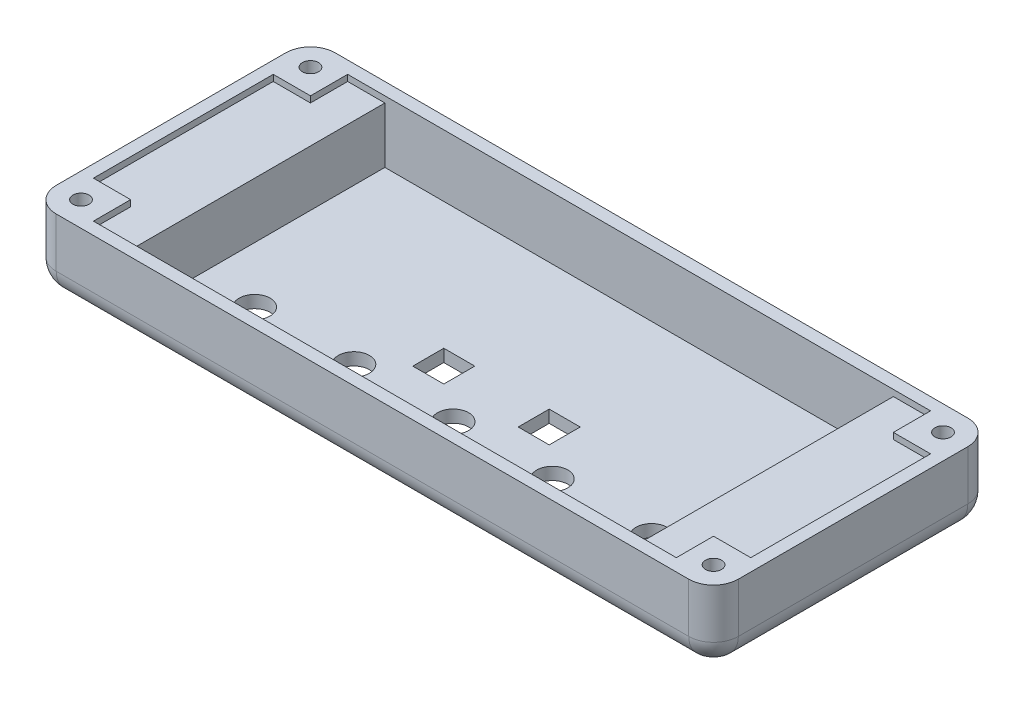
from build123d import *

# Parameters (mm, degrees)
SKETCH1_W           = 110
SKETCH1_H           = 45
BOSS_EXTRUDE1_DEPTH = 2
SKETCH3_W           = 110
SKETCH3_H           = 45
SKETCH3_W_2         = 106
SKETCH3_H_2         = 41
BOSS_EXTRUDE2_DEPTH = 10
SKETCH4_W           = 12
SKETCH4_H           = 41
BOSS_EXTRUDE3_DEPTH = 9
SKETCH5_W           = 6
SKETCH5_H           = 6
BOSS_EXTRUDE4_DEPTH = 1
SKETCH6_W           = 6
SKETCH6_H           = 6
BOSS_EXTRUDE5_DEPTH = 1
FILLET1_R           = 4
FILLET2_R           = 4
SKETCH7_R           = 1.3
CUT_EXTRUDE1_DEPTH  = 8
SKETCH9_R           = 2.5
SKETCH9_W           = 5
SKETCH9_H           = 5
CUT_EXTRUDE3_DEPTH  = 5
CUT_EXTRUDE4_DEPTH  = 1


with BuildPart() as part:
    # Sketch1 → Boss-Extrude1 (new body)
    with BuildSketch(Plane(origin=(0, 0, 0), x_dir=(1, 0, 0), z_dir=(0, 1, 0))):
        Rectangle(SKETCH1_W, SKETCH1_H)
    extrude(amount=BOSS_EXTRUDE1_DEPTH)

    # Sketch3 → Boss-Extrude2 (add)
    with BuildSketch(Plane(origin=(0, 2, 0), x_dir=(1, 0, 0), z_dir=(0, 1, 0))):
        Rectangle(SKETCH3_W, SKETCH3_H)
        Rectangle(SKETCH3_W_2, SKETCH3_H_2, mode=Mode.SUBTRACT)
    extrude(amount=BOSS_EXTRUDE2_DEPTH)

    # Sketch4 → Boss-Extrude3 (add)
    with BuildSketch(Plane(origin=(0, 2, 0), x_dir=(1, 0, 0), z_dir=(0, 1, 0))):
        with Locations((-47, 0)):
            Rectangle(SKETCH4_W, SKETCH4_H)
        with Locations((47, 0)):
            Rectangle(SKETCH4_W, SKETCH4_H)
    extrude(amount=BOSS_EXTRUDE3_DEPTH)

    # Sketch5 → Boss-Extrude4 (add)
    with BuildSketch(Plane(origin=(0, 11, 0), x_dir=(1, 0, 0), z_dir=(0, 1, 0))):
        with Locations((-50, 17.5)):
            Rectangle(SKETCH5_W, SKETCH5_H)
        with Locations((-50, -17.5)):
            Rectangle(SKETCH5_W, SKETCH5_H)
    extrude(amount=BOSS_EXTRUDE4_DEPTH)

    # Sketch6 → Boss-Extrude5 (add)
    with BuildSketch(Plane(origin=(0, 11, 0), x_dir=(1, 0, 0), z_dir=(0, 1, 0))):
        with Locations((50, 17.5)):
            Rectangle(SKETCH6_W, SKETCH6_H)
        with Locations((50, -17.5)):
            Rectangle(SKETCH6_W, SKETCH6_H)
    extrude(amount=BOSS_EXTRUDE5_DEPTH)

    # Fillet1
    fillet1_edges = [part.edges().sort_by_distance(p)[0] for p in [
        (55, 6, -22.5),
        (55, 6, 22.5),
        (-55, 6, 22.5),
        (-55, 6, -22.5),
    ]]
    fillet(fillet1_edges, radius=FILLET1_R)

    # Fillet2
    fillet2_edges = [part.edges().sort_by_distance(p)[0] for p in [
        (53.828427125, 0, 21.328427125),
        (53.828427125, 0, -21.328427125),
        (55, 0, 0),
        (-53.828427125, 0, 21.328427125),
        (0, 0, 22.5),
        (-53.828427125, 0, -21.328427125),
        (-55, 0, 0),
        (0, 0, -22.5),
    ]]
    fillet(fillet2_edges, radius=FILLET2_R)

    # Sketch7 → Cut-Extrude1 (cut)
    with BuildSketch(Plane(origin=(0, 12, 0), x_dir=(1, 0, 0), z_dir=(0, 1, 0))):
        with Locations((-51, 18.5)):
            Circle(SKETCH7_R)
        with Locations((51, 18.5)):
            Circle(SKETCH7_R)
        with Locations((51, -18.5)):
            Circle(SKETCH7_R)
        with Locations((-51, -18.5)):
            Circle(SKETCH7_R)
    extrude(amount=-CUT_EXTRUDE1_DEPTH, mode=Mode.SUBTRACT)

    # Sketch9 → Cut-Extrude3 (cut)
    with BuildSketch(Plane.XZ):
        with Locations((-32, 9.5)):
            Circle(SKETCH9_R)
        with Locations((-16, 9.5)):
            Circle(SKETCH9_R)
        with Locations((0, 9.5)):
            Circle(SKETCH9_R)
        with Locations((16, 9.5)):
            Circle(SKETCH9_R)
        with Locations((32, 9.5)):
            Circle(SKETCH9_R)
        with Locations((-8.5, 2.5)):
            Rectangle(SKETCH9_W, SKETCH9_H)
        with Locations((8.5, 2.5)):
            Rectangle(SKETCH9_W, SKETCH9_H)
    extrude(amount=-CUT_EXTRUDE3_DEPTH, mode=Mode.SUBTRACT)

    # Sketch10 → Cut-Extrude4 (cut)
    # profile 1 of 27: a face of its own
    with BuildSketch(Plane.XZ):
        with BuildLine():
            Line((-37.435897436, 13.982271635), (-37.224559295, 14.108974359))
            add(Edge.make_bspline(
                [(-37.224559295, 14.108974359), (-37.204903411, 14.076071227), (-37.167243496, 14.013030096), (-37.104421097, 13.927845781), (-37.03932616, 13.85544424), (-36.971476636, 13.796246664), (-36.901286674, 13.749640316), (-36.828298064, 13.716638722), (-36.75275677, 13.696055882), (-36.701346898, 13.69355582), (-36.67568109, 13.692307692)],
                knots=[0, 0, 0, 0, 1.272034388, 2.437168799, 3.508375237, 4.49857839, 5.41946034, 6.295179144, 7.148887113, 8, 8, 8, 8], degree=3))
            add(Edge.make_bspline(
                [(-36.67568109, 13.692307692), (-36.653761904, 13.692918173), (-36.610307066, 13.694128451), (-36.546334035, 13.705757596), (-36.484204176, 13.723623402), (-36.425198007, 13.749209782), (-36.37012971, 13.780165843), (-36.321839214, 13.81755597), (-36.28009199, 13.859417545), (-36.245942623, 13.906119441), (-36.219742597, 13.956345976), (-36.199605406, 14.007900227), (-36.188430353, 14.061592062), (-36.186746958, 14.097742392), (-36.185897436, 14.115985577)],
                knots=[0, 0, 0, 0, 1.095163259, 2.171163733, 3.241058638, 4.321873601, 5.38011039, 6.391990106, 7.366004449, 8.327778327, 9.272591725, 10.192022065, 11.087607919, 12, 12, 12, 12], degree=3))
            add(Edge.make_bspline(
                [(-36.185897436, 14.115985577), (-36.186950515, 14.13680047), (-36.189091271, 14.179114105), (-36.207185185, 14.241542428), (-36.235648933, 14.303322835), (-36.261907964, 14.341538025), (-36.275540865, 14.361378205)],
                knots=[0, 0, 0, 0, 0.938893495, 1.908633276, 2.914225137, 4, 4, 4, 4], degree=3))
            add(Edge.make_bspline(
                [(-36.275540865, 14.361378205), (-36.286734161, 14.375697365), (-36.310233086, 14.40575865), (-36.350631309, 14.450505246), (-36.398035676, 14.49666126), (-36.45082393, 14.545989158), (-36.510918993, 14.596194727), (-36.576438646, 14.649672068), (-36.649055689, 14.70438748), (-36.6999839, 14.74108217), (-36.726262019, 14.760016026)],
                knots=[0, 0, 0, 0, 0.722233717, 1.516239348, 2.393582979, 3.351407094, 4.387010283, 5.505090956, 6.712668013, 8, 8, 8, 8], degree=3))
            add(Edge.make_bspline(
                [(-36.726262019, 14.760016026), (-36.752564874, 14.778750731), (-36.802853928, 14.814570061), (-36.873181487, 14.867730264), (-36.936070389, 14.916333028), (-36.991241115, 14.960835894), (-37.038669399, 15.001244897), (-37.078728978, 15.037171997), (-37.110399376, 15.069588826), (-37.128010505, 15.090618356), (-37.135917468, 15.100060096)],
                knots=[0, 0, 0, 0, 1.452282411, 2.77665338, 3.964542531, 5.026858415, 5.96415736, 6.766646006, 7.446254459, 8, 8, 8, 8], degree=3))
            add(Edge.make_bspline(
                [(-37.135917468, 15.100060096), (-37.146969286, 15.114775122), (-37.168704169, 15.143714197), (-37.197394173, 15.188946238), (-37.22177929, 15.23524857), (-37.240895241, 15.282745616), (-37.25699254, 15.330770566), (-37.267819634, 15.379950027), (-37.274599203, 15.430063326), (-37.275293479, 15.463787255), (-37.275641026, 15.480669071)],
                knots=[0, 0, 0, 0, 1.068054152, 2.10047183, 3.106115577, 4.101338837, 5.06977816, 6.043150881, 7.020423561, 8, 8, 8, 8], degree=3))
            add(Edge.make_bspline(
                [(-37.275641026, 15.480669071), (-37.274708734, 15.507118909), (-37.272864076, 15.559453241), (-37.257263707, 15.635903834), (-37.232640211, 15.708894132), (-37.198143863, 15.777701513), (-37.153674325, 15.840534357), (-37.102212915, 15.898115419), (-37.040918996, 15.946521549), (-36.973667122, 15.988815876), (-36.900055428, 16.021920109), (-36.822919068, 16.046892237), (-36.742135446, 16.061041707), (-36.687418921, 16.063072253), (-36.659655449, 16.064102564)],
                knots=[0, 0, 0, 0, 1.005424448, 1.989358655, 2.955360095, 3.929531133, 4.905563448, 5.876582895, 6.856512386, 7.866279853, 8.892233794, 9.918561126, 10.94386622, 12, 12, 12, 12], degree=3))
            add(Edge.make_bspline(
                [(-36.659655449, 16.064102564), (-36.630195377, 16.063086456), (-36.571608697, 16.061065741), (-36.485430686, 16.043496076), (-36.402458746, 16.014424167), (-36.335713557, 15.981432269), (-36.28347587, 15.948481257), (-36.243638204, 15.918467097), (-36.203268596, 15.883913448), (-36.162041414, 15.844728272), (-36.120655229, 15.800552022), (-36.07849562, 15.751687244), (-36.035463999, 15.698432561), (-36.007781242, 15.66041506), (-35.993589744, 15.640925481)],
                knots=[0, 0, 0, 0, 1.286793592, 2.559021753, 3.825965368, 5.121522368, 5.803751409, 6.523245864, 7.299691795, 8.125521123, 9.008227632, 9.944561021, 10.946284179, 12, 12, 12, 12], degree=3))
            Line((-35.993589744, 15.640925481), (-36.196414263, 15.487179487))
            add(Edge.make_bspline(
                [(-36.196414263, 15.487179487), (-36.208661357, 15.502957123), (-36.232246398, 15.533341161), (-36.268053175, 15.575892101), (-36.301802209, 15.614761015), (-36.335052494, 15.648521821), (-36.366047945, 15.679023344), (-36.396131547, 15.705137456), (-36.424870369, 15.727120025), (-36.461096734, 15.75057971), (-36.50660939, 15.773834356), (-36.563741202, 15.793512269), (-36.623445684, 15.805337313), (-36.664109706, 15.806900804), (-36.684695513, 15.807692308)],
                knots=[0, 0, 0, 0, 1.181633172, 2.275549214, 3.290209073, 4.226197932, 5.078386478, 5.862611352, 6.581680152, 7.217281963, 8.414376989, 9.595101626, 10.782541182, 12, 12, 12, 12], degree=3))
            add(Edge.make_bspline(
                [(-36.684695513, 15.807692308), (-36.7105216, 15.806826808), (-36.760324777, 15.805157773), (-36.831032088, 15.786929212), (-36.894670606, 15.758227883), (-36.94935101, 15.718002899), (-36.994877422, 15.670345047), (-37.027809893, 15.615503007), (-37.047631439, 15.554944148), (-37.05005021, 15.512700108), (-37.051282051, 15.491185897)],
                knots=[0, 0, 0, 0, 1.14458467, 2.207223713, 3.21896685, 4.227309161, 5.202851033, 6.127160689, 7.046193047, 8, 8, 8, 8], degree=3))
            add(Edge.make_bspline(
                [(-37.051282051, 15.491185897), (-37.051001247, 15.477791984), (-37.050439178, 15.450982256), (-37.042600037, 15.411374097), (-37.032529087, 15.371865998), (-37.016570065, 15.332635582), (-36.994537705, 15.292996754), (-36.965605437, 15.252266941), (-36.929167356, 15.210087149), (-36.901255205, 15.182653311), (-36.886518429, 15.168169071)],
                knots=[0, 0, 0, 0, 0.858281714, 1.717966888, 2.583508476, 3.4729293, 4.427298488, 5.488583878, 6.674047936, 8, 8, 8, 8], degree=3))
            add(Edge.make_bspline(
                [(-36.886518429, 15.168169071), (-36.881046021, 15.163285481), (-36.86804483, 15.151683189), (-36.844276311, 15.132688703), (-36.812888598, 15.109258151), (-36.774701312, 15.080267211), (-36.729010339, 15.046637595), (-36.675810656, 15.008799301), (-36.615695276, 14.965523973), (-36.573036764, 14.935268587), (-36.550480769, 14.919270833)],
                knots=[0, 0, 0, 0, 0.420754252, 0.999615792, 1.744751191, 2.668019286, 3.750313428, 4.999500688, 6.413464383, 8, 8, 8, 8], degree=3))
            add(Edge.make_bspline(
                [(-36.550480769, 14.919270833), (-36.523347974, 14.899527005), (-36.470809077, 14.861295818), (-36.396053662, 14.803856047), (-36.328272371, 14.747679069), (-36.267227225, 14.693123635), (-36.212315148, 14.640603569), (-36.164145348, 14.589487012), (-36.122227004, 14.540140174), (-36.077098991, 14.476874049), (-36.030986263, 14.399173274), (-35.991385186, 14.303974532), (-35.966414938, 14.208405732), (-35.96314957, 14.144172277), (-35.961538462, 14.112479968)],
                knots=[0, 0, 0, 0, 1.163667725, 2.253281268, 3.268753668, 4.215851969, 5.092017293, 5.902905408, 6.650798638, 7.335211899, 8.59617414, 9.77448103, 10.901945474, 12, 12, 12, 12], degree=3))
            add(Edge.make_bspline(
                [(-35.961538462, 14.112479968), (-35.962007846, 14.09006685), (-35.9629375, 14.045675862), (-35.973623867, 13.980493664), (-35.98928077, 13.9171859), (-36.012878794, 13.856535105), (-36.04168105, 13.797431703), (-36.07822837, 13.74142606), (-36.120591002, 13.687278633), (-36.169186549, 13.636433282), (-36.222362193, 13.589757427), (-36.278564832, 13.548236669), (-36.337886456, 13.513616438), (-36.400005253, 13.485365837), (-36.464935494, 13.463270467), (-36.532655339, 13.447261275), (-36.603276419, 13.437435767), (-36.651276763, 13.436415938), (-36.67568109, 13.435897436)],
                knots=[0, 0, 0, 0, 0.983748083, 1.948392443, 2.894712957, 3.844097841, 4.80183111, 5.778335162, 6.776009319, 7.81870978, 8.863265674, 9.881300176, 10.883814829, 11.87499822, 12.874611388, 13.892143829, 14.928324115, 16, 16, 16, 16], degree=3))
            add(Edge.make_bspline(
                [(-36.67568109, 13.435897436), (-36.694563478, 13.436262566), (-36.732090449, 13.436988227), (-36.787597222, 13.443403427), (-36.841982643, 13.452479929), (-36.894564273, 13.466889979), (-36.946019567, 13.484373534), (-36.996124734, 13.505900915), (-37.044904058, 13.531698916), (-37.092630903, 13.561195362), (-37.139183885, 13.595522323), (-37.184126362, 13.635503391), (-37.228932923, 13.680035895), (-37.272281064, 13.730329155), (-37.315047595, 13.785570642), (-37.356389316, 13.846277202), (-37.397161972, 13.912118169), (-37.422744449, 13.958450373), (-37.435897436, 13.982271635)],
                knots=[0, 0, 0, 0, 0.915332311, 1.819136955, 2.706846663, 3.586547465, 4.459518054, 5.340707479, 6.227863349, 7.133153174, 8.059268498, 9.028702269, 10.047606654, 11.120612155, 12.245963614, 13.433783089, 14.680604001, 16, 16, 16, 16], degree=3))
        make_face()
    # profile 2 of 27: a face of its own
    with BuildSketch(Plane.XZ):
        Polygon((-35.737179487, 15.743589744), (-35.737179487, 16), (-34.423076923, 16), (-34.423076923, 15.743589744), (-34.967948718, 15.743589744), (-34.967948718, 13.5), (-35.192307692, 13.5), (-35.192307692, 15.743589744), align=None)
    # profile 3 of 27: a face of its own
    with BuildSketch(Plane.XZ):
        Polygon((-33.012820513, 16), (-31.858974359, 13.5), (-32.102864583, 13.5), (-32.472455929, 14.301282051), (-33.605769231, 14.301282051), (-33.985877404, 13.5), (-34.230769231, 13.5), (-33.044871795, 16), align=None)
        Polygon((-33.03135016, 15.512720353), (-33.484074519, 14.557692308), (-32.590645032, 14.557692308), align=None, mode=Mode.SUBTRACT)
    # profile 4 of 27: a face of its own
    with BuildSketch(Plane.XZ):
        Polygon((-31.698717949, 15.743589744), (-31.698717949, 16), (-30.384615385, 16), (-30.384615385, 15.743589744), (-30.929487179, 15.743589744), (-30.929487179, 13.5), (-31.153846154, 13.5), (-31.153846154, 15.743589744), align=None)
    # profile 5 of 27: a face of its own
    with BuildSketch(Plane.XZ):
        with BuildLine():
            Line((-30, 16), (-29.775641026, 16))
            Line((-29.775641026, 16), (-29.775641026, 14.502103365))
            add(Edge.make_bspline(
                [(-29.775641026, 14.502103365), (-29.775674414, 14.48090284), (-29.775737775, 14.440671189), (-29.775314551, 14.383408117), (-29.774129287, 14.332499218), (-29.773382031, 14.287748255), (-29.771719649, 14.249360579), (-29.770363902, 14.217128214), (-29.768620647, 14.191203784), (-29.766525563, 14.176074551), (-29.765625, 14.169571314)],
                knots=[0, 0, 0, 0, 1.528628734, 2.90083645, 4.128790002, 5.200304208, 6.127813768, 6.898992206, 7.526736466, 8, 8, 8, 8], degree=3))
            add(Edge.make_bspline(
                [(-29.765625, 14.169571314), (-29.761926815, 14.14610934), (-29.754738825, 14.100507391), (-29.736419984, 14.035572904), (-29.710836054, 13.977050434), (-29.680519595, 13.923113797), (-29.64056773, 13.875264254), (-29.592708062, 13.831184502), (-29.534723942, 13.792633213), (-29.47025208, 13.757382633), (-29.400762625, 13.729050432), (-29.329754578, 13.7076266), (-29.258295307, 13.694570243), (-29.210455189, 13.693058429), (-29.186698718, 13.692307692)],
                knots=[0, 0, 0, 0, 1.035780045, 2.013197591, 2.933192213, 3.817615948, 4.702609284, 5.640816605, 6.646850145, 7.73207398, 8.84249596, 9.914020372, 10.964143139, 12, 12, 12, 12], degree=3))
            add(Edge.make_bspline(
                [(-29.186698718, 13.692307692), (-29.166303189, 13.693074728), (-29.125629931, 13.69460437), (-29.065196766, 13.704076821), (-29.006339545, 13.721148653), (-28.948767631, 13.743177052), (-28.894802642, 13.772282474), (-28.844414469, 13.805904502), (-28.799440231, 13.845340843), (-28.758398804, 13.888983946), (-28.722659564, 13.93822666), (-28.691680177, 13.991996759), (-28.666304513, 14.051103435), (-28.653773424, 14.092642308), (-28.647335737, 14.113982372)],
                knots=[0, 0, 0, 0, 0.994687771, 1.983630487, 2.973142513, 3.978332533, 4.983357753, 5.956394766, 6.925816176, 7.893390482, 8.871859704, 9.88551698, 10.913711441, 12, 12, 12, 12], degree=3))
            add(Edge.make_bspline(
                [(-28.647335737, 14.113982372), (-28.645192791, 14.122802782), (-28.640417442, 14.142458211), (-28.635955267, 14.175687704), (-28.631307749, 14.214894392), (-28.628083056, 14.260359973), (-28.624939327, 14.311932096), (-28.623058561, 14.369879423), (-28.622189251, 14.433991538), (-28.621930194, 14.478732368), (-28.621794872, 14.502103365)],
                knots=[0, 0, 0, 0, 0.558680831, 1.244966039, 2.062412453, 2.990489873, 4.051219941, 5.244515665, 6.560634259, 8, 8, 8, 8], degree=3))
            Line((-28.621794872, 14.502103365), (-28.621794872, 16))
            Line((-28.621794872, 16), (-28.397435897, 16))
            Line((-28.397435897, 16), (-28.397435897, 14.490084135))
            add(Edge.make_bspline(
                [(-28.397435897, 14.490084135), (-28.397617412, 14.462871007), (-28.397971649, 14.409762933), (-28.401043489, 14.331940534), (-28.405941346, 14.258116976), (-28.412861409, 14.188282336), (-28.422030697, 14.122686508), (-28.432227283, 14.06075453), (-28.445212664, 14.002930964), (-28.460379379, 13.948764951), (-28.477717627, 13.89720387), (-28.500175591, 13.848269146), (-28.525478805, 13.800473146), (-28.555489271, 13.754538782), (-28.589211687, 13.710262673), (-28.627391459, 13.667913334), (-28.66876586, 13.626814015), (-28.714022688, 13.588018968), (-28.762415921, 13.552441341), (-28.813801605, 13.521157219), (-28.867785012, 13.494711778), (-28.924225816, 13.472943261), (-28.983148104, 13.45657569), (-29.044553361, 13.44437915), (-29.108581356, 13.437448938), (-29.152127539, 13.436418987), (-29.174178686, 13.435897436)],
                knots=[0, 0, 0, 0, 1.316592851, 2.569410997, 3.76748051, 4.895814652, 5.963796859, 6.97159953, 7.931736103, 8.829262218, 9.692595152, 10.560224239, 11.431080259, 12.30701507, 13.211635791, 14.121146779, 15.063487852, 16.031507147, 17.00238618, 17.966455255, 18.938106653, 19.907068911, 20.888905087, 21.893141452, 22.933117798, 24, 24, 24, 24], degree=3))
            add(Edge.make_bspline(
                [(-29.174178686, 13.435897436), (-29.198228045, 13.436457983), (-29.245412801, 13.437557773), (-29.314939992, 13.443859737), (-29.38159299, 13.455730019), (-29.446075759, 13.470844265), (-29.5075104, 13.491689791), (-29.566720003, 13.516045595), (-29.622690489, 13.545957923), (-29.676329867, 13.579238918), (-29.726204693, 13.616685089), (-29.771988552, 13.657499498), (-29.813757031, 13.701028339), (-29.8508061, 13.747742886), (-29.883749589, 13.79727982), (-29.912128313, 13.849779277), (-29.936494916, 13.905220931), (-29.949071035, 13.943758932), (-29.955428686, 13.963241186)],
                knots=[0, 0, 0, 0, 1.13879206, 2.234305948, 3.301075583, 4.341971843, 5.366689343, 6.369221514, 7.369726634, 8.367512178, 9.355451585, 10.318319045, 11.268648973, 12.207971039, 13.137398894, 14.081662264, 15.030215811, 16, 16, 16, 16], degree=3))
            add(Edge.make_bspline(
                [(-29.955428686, 13.963241186), (-29.959126656, 13.976550168), (-29.967147636, 14.005417645), (-29.975737134, 14.053193709), (-29.982957906, 14.108204364), (-29.989747591, 14.170453377), (-29.993753989, 14.239988996), (-29.997266446, 14.316781079), (-30.000024745, 14.40092248), (-30.000008479, 14.459532849), (-30, 14.490084135)],
                knots=[0, 0, 0, 0, 0.625038921, 1.35572334, 2.194682327, 3.136881307, 4.189498639, 5.346923369, 6.617055217, 8, 8, 8, 8], degree=3))
            Line((-30, 14.490084135), (-30, 16))
        make_face()
    # profile 6 of 27: a face of its own
    with BuildSketch(Plane.XZ):
        with BuildLine():
            Line((-28.012820513, 13.982271635), (-27.801482372, 14.108974359))
            add(Edge.make_bspline(
                [(-27.801482372, 14.108974359), (-27.781826488, 14.076071227), (-27.744166573, 14.013030096), (-27.681344174, 13.927845781), (-27.616249237, 13.85544424), (-27.548399713, 13.796246664), (-27.47820975, 13.749640316), (-27.405221141, 13.716638722), (-27.329679847, 13.696055882), (-27.278269975, 13.69355582), (-27.252604167, 13.692307692)],
                knots=[0, 0, 0, 0, 1.272034388, 2.437168799, 3.508375237, 4.49857839, 5.41946034, 6.295179144, 7.148887113, 8, 8, 8, 8], degree=3))
            add(Edge.make_bspline(
                [(-27.252604167, 13.692307692), (-27.230684981, 13.692918173), (-27.187230143, 13.694128451), (-27.123257112, 13.705757596), (-27.061127253, 13.723623402), (-27.002121083, 13.749209782), (-26.947052787, 13.780165843), (-26.898762291, 13.81755597), (-26.857015067, 13.859417545), (-26.822865699, 13.906119441), (-26.796665674, 13.956345976), (-26.776528483, 14.007900227), (-26.76535343, 14.061592062), (-26.763670035, 14.097742392), (-26.762820513, 14.115985577)],
                knots=[0, 0, 0, 0, 1.095163259, 2.171163733, 3.241058638, 4.321873601, 5.38011039, 6.391990106, 7.366004449, 8.327778327, 9.272591725, 10.192022065, 11.087607919, 12, 12, 12, 12], degree=3))
            add(Edge.make_bspline(
                [(-26.762820513, 14.115985577), (-26.763873592, 14.13680047), (-26.766014348, 14.179114105), (-26.784108262, 14.241542428), (-26.81257201, 14.303322835), (-26.838831041, 14.341538025), (-26.852463942, 14.361378205)],
                knots=[0, 0, 0, 0, 0.938893495, 1.908633276, 2.914225137, 4, 4, 4, 4], degree=3))
            add(Edge.make_bspline(
                [(-26.852463942, 14.361378205), (-26.863657238, 14.375697365), (-26.887156163, 14.40575865), (-26.927554386, 14.450505246), (-26.974958753, 14.49666126), (-27.027747007, 14.545989158), (-27.08784207, 14.596194727), (-27.153361723, 14.649672068), (-27.225978766, 14.70438748), (-27.276906977, 14.74108217), (-27.303185096, 14.760016026)],
                knots=[0, 0, 0, 0, 0.722233717, 1.516239348, 2.393582979, 3.351407094, 4.387010283, 5.505090956, 6.712668013, 8, 8, 8, 8], degree=3))
            add(Edge.make_bspline(
                [(-27.303185096, 14.760016026), (-27.329487951, 14.778750731), (-27.379777005, 14.814570061), (-27.450104564, 14.867730264), (-27.512993466, 14.916333028), (-27.568164192, 14.960835894), (-27.615592476, 15.001244897), (-27.655652055, 15.037171997), (-27.687322453, 15.069588826), (-27.704933582, 15.090618356), (-27.712840545, 15.100060096)],
                knots=[0, 0, 0, 0, 1.452282411, 2.77665338, 3.964542531, 5.026858415, 5.96415736, 6.766646006, 7.446254459, 8, 8, 8, 8], degree=3))
            add(Edge.make_bspline(
                [(-27.712840545, 15.100060096), (-27.723892363, 15.114775122), (-27.745627246, 15.143714197), (-27.77431725, 15.188946238), (-27.798702366, 15.23524857), (-27.817818318, 15.282745616), (-27.833915617, 15.330770566), (-27.844742711, 15.379950027), (-27.85152228, 15.430063326), (-27.852216556, 15.463787255), (-27.852564103, 15.480669071)],
                knots=[0, 0, 0, 0, 1.068054152, 2.10047183, 3.106115577, 4.101338837, 5.06977816, 6.043150881, 7.020423561, 8, 8, 8, 8], degree=3))
            add(Edge.make_bspline(
                [(-27.852564103, 15.480669071), (-27.85163181, 15.507118909), (-27.849787153, 15.559453241), (-27.834186784, 15.635903834), (-27.809563288, 15.708894132), (-27.77506694, 15.777701513), (-27.730597402, 15.840534357), (-27.679135992, 15.898115419), (-27.617842073, 15.946521549), (-27.550590199, 15.988815876), (-27.476978505, 16.021920109), (-27.399842145, 16.046892237), (-27.319058522, 16.061041707), (-27.264341998, 16.063072253), (-27.236578526, 16.064102564)],
                knots=[0, 0, 0, 0, 1.005424448, 1.989358655, 2.955360095, 3.929531133, 4.905563448, 5.876582895, 6.856512386, 7.866279853, 8.892233794, 9.918561126, 10.94386622, 12, 12, 12, 12], degree=3))
            add(Edge.make_bspline(
                [(-27.236578526, 16.064102564), (-27.207118454, 16.063086456), (-27.148531774, 16.061065741), (-27.062353763, 16.043496076), (-26.979381823, 16.014424167), (-26.912636634, 15.981432269), (-26.860398947, 15.948481257), (-26.820561281, 15.918467097), (-26.780191673, 15.883913448), (-26.738964491, 15.844728272), (-26.697578306, 15.800552022), (-26.655418697, 15.751687244), (-26.612387076, 15.698432561), (-26.584704319, 15.66041506), (-26.570512821, 15.640925481)],
                knots=[0, 0, 0, 0, 1.286793592, 2.559021753, 3.825965368, 5.121522368, 5.803751409, 6.523245864, 7.299691795, 8.125521123, 9.008227632, 9.944561021, 10.946284179, 12, 12, 12, 12], degree=3))
            Line((-26.570512821, 15.640925481), (-26.77333734, 15.487179487))
            add(Edge.make_bspline(
                [(-26.77333734, 15.487179487), (-26.785584434, 15.502957123), (-26.809169475, 15.533341161), (-26.844976251, 15.575892101), (-26.878725286, 15.614761015), (-26.911975571, 15.648521821), (-26.942971022, 15.679023344), (-26.973054624, 15.705137456), (-27.001793446, 15.727120025), (-27.038019811, 15.75057971), (-27.083532467, 15.773834356), (-27.140664279, 15.793512269), (-27.200368761, 15.805337313), (-27.241032783, 15.806900804), (-27.26161859, 15.807692308)],
                knots=[0, 0, 0, 0, 1.181633172, 2.275549214, 3.290209073, 4.226197932, 5.078386478, 5.862611352, 6.581680152, 7.217281963, 8.414376989, 9.595101626, 10.782541182, 12, 12, 12, 12], degree=3))
            add(Edge.make_bspline(
                [(-27.26161859, 15.807692308), (-27.287444677, 15.806826808), (-27.337247854, 15.805157773), (-27.407955165, 15.786929212), (-27.471593683, 15.758227883), (-27.526274087, 15.718002899), (-27.571800499, 15.670345047), (-27.60473297, 15.615503007), (-27.624554516, 15.554944148), (-27.626973287, 15.512700108), (-27.628205128, 15.491185897)],
                knots=[0, 0, 0, 0, 1.14458467, 2.207223713, 3.21896685, 4.227309161, 5.202851033, 6.127160689, 7.046193047, 8, 8, 8, 8], degree=3))
            add(Edge.make_bspline(
                [(-27.628205128, 15.491185897), (-27.627924323, 15.477791984), (-27.627362255, 15.450982256), (-27.619523114, 15.411374097), (-27.609452164, 15.371865998), (-27.593493142, 15.332635582), (-27.571460782, 15.292996754), (-27.542528513, 15.252266941), (-27.506090433, 15.210087149), (-27.478178282, 15.182653311), (-27.463441506, 15.168169071)],
                knots=[0, 0, 0, 0, 0.858281714, 1.717966888, 2.583508476, 3.4729293, 4.427298488, 5.488583878, 6.674047936, 8, 8, 8, 8], degree=3))
            add(Edge.make_bspline(
                [(-27.463441506, 15.168169071), (-27.457969098, 15.163285481), (-27.444967907, 15.151683189), (-27.421199388, 15.132688703), (-27.389811675, 15.109258151), (-27.351624389, 15.080267211), (-27.305933416, 15.046637595), (-27.252733733, 15.008799301), (-27.192618353, 14.965523973), (-27.149959841, 14.935268587), (-27.127403846, 14.919270833)],
                knots=[0, 0, 0, 0, 0.420754252, 0.999615792, 1.744751191, 2.668019286, 3.750313428, 4.999500688, 6.413464383, 8, 8, 8, 8], degree=3))
            add(Edge.make_bspline(
                [(-27.127403846, 14.919270833), (-27.100271051, 14.899527005), (-27.047732154, 14.861295818), (-26.972976739, 14.803856047), (-26.905195448, 14.747679069), (-26.844150302, 14.693123635), (-26.789238225, 14.640603569), (-26.741068424, 14.589487012), (-26.699150081, 14.540140174), (-26.654022068, 14.476874049), (-26.60790934, 14.399173274), (-26.568308263, 14.303974532), (-26.543338015, 14.208405732), (-26.540072647, 14.144172277), (-26.538461538, 14.112479968)],
                knots=[0, 0, 0, 0, 1.163667725, 2.253281268, 3.268753668, 4.215851969, 5.092017293, 5.902905408, 6.650798638, 7.335211899, 8.59617414, 9.77448103, 10.901945474, 12, 12, 12, 12], degree=3))
            add(Edge.make_bspline(
                [(-26.538461538, 14.112479968), (-26.538930923, 14.09006685), (-26.539860576, 14.045675862), (-26.550546943, 13.980493664), (-26.566203847, 13.9171859), (-26.589801871, 13.856535105), (-26.618604127, 13.797431703), (-26.655151447, 13.74142606), (-26.697514079, 13.687278633), (-26.746109625, 13.636433282), (-26.79928527, 13.589757427), (-26.855487909, 13.548236669), (-26.914809533, 13.513616438), (-26.97692833, 13.485365837), (-27.041858571, 13.463270467), (-27.109578416, 13.447261275), (-27.180199496, 13.437435767), (-27.22819984, 13.436415938), (-27.252604167, 13.435897436)],
                knots=[0, 0, 0, 0, 0.983748083, 1.948392443, 2.894712957, 3.844097841, 4.80183111, 5.778335162, 6.776009319, 7.81870978, 8.863265674, 9.881300176, 10.883814829, 11.87499822, 12.874611388, 13.892143829, 14.928324115, 16, 16, 16, 16], degree=3))
            add(Edge.make_bspline(
                [(-27.252604167, 13.435897436), (-27.271486555, 13.436262566), (-27.309013526, 13.436988227), (-27.364520299, 13.443403427), (-27.41890572, 13.452479929), (-27.47148735, 13.466889979), (-27.522942644, 13.484373534), (-27.573047811, 13.505900915), (-27.621827135, 13.531698916), (-27.66955398, 13.561195362), (-27.716106962, 13.595522323), (-27.761049439, 13.635503391), (-27.805856, 13.680035895), (-27.849204141, 13.730329155), (-27.891970672, 13.785570642), (-27.933312393, 13.846277202), (-27.974085049, 13.912118169), (-27.999667526, 13.958450373), (-28.012820513, 13.982271635)],
                knots=[0, 0, 0, 0, 0.915332311, 1.819136955, 2.706846663, 3.586547465, 4.459518054, 5.340707479, 6.227863349, 7.133153174, 8.059268498, 9.028702269, 10.047606654, 11.120612155, 12.245963614, 13.433783089, 14.680604001, 16, 16, 16, 16], degree=3))
        make_face()
    # profile 7 of 27: a face of its own
    with BuildSketch(Plane.XZ):
        with BuildLine():
            Line((-22.679487179, 16), (-22.189202724, 16))
            add(Edge.make_bspline(
                [(-22.189202724, 16), (-22.155480649, 15.999962931), (-22.090867654, 15.999891906), (-21.998214042, 15.997738516), (-21.914064234, 15.994862307), (-21.838599676, 15.990875241), (-21.771588178, 15.986163391), (-21.713332964, 15.979554791), (-21.663376138, 15.97265458), (-21.63344296, 15.96563929), (-21.619791667, 15.962439904)],
                knots=[0, 0, 0, 0, 1.415646017, 2.712440637, 3.8905458, 4.950247383, 5.884950622, 6.709939814, 7.411656543, 8, 8, 8, 8], degree=3))
            add(Edge.make_bspline(
                [(-21.619791667, 15.962439904), (-21.602510571, 15.95770994), (-21.568355587, 15.948361467), (-21.519140557, 15.929637379), (-21.472316381, 15.907435832), (-21.427722411, 15.882133018), (-21.385906637, 15.852643329), (-21.346245179, 15.820162174), (-21.309088051, 15.783939625), (-21.274644199, 15.744381954), (-21.243012201, 15.702153232), (-21.215776713, 15.656623068), (-21.192971551, 15.608557851), (-21.173412072, 15.557991015), (-21.159334604, 15.504497927), (-21.148729676, 15.448450275), (-21.141998513, 15.389854068), (-21.141353826, 15.349811305), (-21.141025641, 15.329427083)],
                knots=[0, 0, 0, 0, 0.999701418, 1.975846123, 2.934577507, 3.890451536, 4.834027766, 5.787354733, 6.749476667, 7.726910423, 8.712836071, 9.690891519, 10.682875813, 11.679750201, 12.712814741, 13.765529915, 14.8625177, 16, 16, 16, 16], degree=3))
            add(Edge.make_bspline(
                [(-21.141025641, 15.329427083), (-21.141326659, 15.308871528), (-21.14191562, 15.268653197), (-21.148984395, 15.209815491), (-21.158505961, 15.15358807), (-21.173146712, 15.100095605), (-21.192322193, 15.049655769), (-21.214816517, 15.001497746), (-21.24194761, 14.956440838), (-21.273122488, 14.914321468), (-21.307802198, 14.875100102), (-21.345840011, 14.839060963), (-21.387082363, 14.806415007), (-21.431398183, 14.777089047), (-21.479219504, 14.751763133), (-21.529821042, 14.729079344), (-21.583642625, 14.710028587), (-21.620887278, 14.700007114), (-21.639823718, 14.694911859)],
                knots=[0, 0, 0, 0, 1.121902311, 2.195077645, 3.232258892, 4.234102512, 5.217864754, 6.176164875, 7.132989551, 8.084763148, 9.034132444, 9.988522005, 10.94243251, 11.903244335, 12.886203696, 13.894208494, 14.929344452, 16, 16, 16, 16], degree=3))
            add(Edge.make_bspline(
                [(-21.639823718, 14.694911859), (-21.655486099, 14.691581158), (-21.689811119, 14.684281734), (-21.746341635, 14.676132836), (-21.812159768, 14.669177407), (-21.887175682, 14.663962309), (-21.971322042, 14.65949776), (-22.064644369, 14.655949121), (-22.167325853, 14.653999226), (-22.23894817, 14.653898659), (-22.276342147, 14.653846154)],
                knots=[0, 0, 0, 0, 0.601384939, 1.31797006, 2.144135048, 3.087295005, 4.142315834, 5.309527816, 6.595305764, 8, 8, 8, 8], degree=3))
            Line((-22.276342147, 14.653846154), (-22.455128205, 14.653846154))
            Line((-22.455128205, 14.653846154), (-22.455128205, 13.5))
            Line((-22.455128205, 13.5), (-22.679487179, 13.5))
            Line((-22.679487179, 13.5), (-22.679487179, 16))
        make_face()
        with BuildLine():
            Line((-22.455128205, 15.743589744), (-22.455128205, 14.91025641))
            Line((-22.455128205, 14.91025641), (-22.017427885, 14.904747596))
            add(Edge.make_bspline(
                [(-22.017427885, 14.904747596), (-21.996056509, 14.904736551), (-21.954799509, 14.904715228), (-21.895202207, 14.907561816), (-21.839909859, 14.910847911), (-21.789092305, 14.915659285), (-21.742726637, 14.922460183), (-21.700735545, 14.92932571), (-21.663444629, 14.939258112), (-21.619802342, 14.952631733), (-21.57117138, 14.975440744), (-21.518265988, 15.008547808), (-21.473429855, 15.050748314), (-21.434631071, 15.098196765), (-21.403841158, 15.150981857), (-21.381301164, 15.207459669), (-21.36805748, 15.26705099), (-21.366281627, 15.307828232), (-21.365384615, 15.328425481)],
                knots=[0, 0, 0, 0, 1.160613943, 2.240541288, 3.23993089, 4.169200891, 5.011653406, 5.7853311, 6.478053781, 7.106038997, 8.262395093, 9.384106736, 10.481365981, 11.59014053, 12.70357646, 13.786202915, 14.881775077, 16, 16, 16, 16], degree=3))
            add(Edge.make_bspline(
                [(-21.365384615, 15.328425481), (-21.366286506, 15.348524419), (-21.368079352, 15.38847862), (-21.381404969, 15.447034878), (-21.403797336, 15.502917524), (-21.43483776, 15.555041156), (-21.472509996, 15.602318874), (-21.516295241, 15.64338825), (-21.566090428, 15.676403752), (-21.612410593, 15.697713239), (-21.653554297, 15.71072415), (-21.689291411, 15.719827607), (-21.729641893, 15.727095898), (-21.774618878, 15.732981257), (-21.82387376, 15.738019443), (-21.877829699, 15.741437998), (-21.936282301, 15.743439039), (-21.976861281, 15.743538292), (-21.997896635, 15.743589744)],
                knots=[0, 0, 0, 0, 1.120700087, 2.227813068, 3.331159281, 4.466773991, 5.599788987, 6.693661531, 7.80175334, 8.91857717, 9.525282508, 10.207424825, 10.974604443, 11.810962634, 12.737642355, 13.736264703, 14.826523623, 16, 16, 16, 16], degree=3))
            Line((-21.997896635, 15.743589744), (-22.455128205, 15.743589744))
        make_face(mode=Mode.SUBTRACT)
    # profile 8 of 27: a face of its own
    with BuildSketch(Plane.XZ):
        with BuildLine():
            Line((-20.628205128, 16), (-20.127904647, 16))
            add(Edge.make_bspline(
                [(-20.127904647, 16), (-20.094518127, 15.999888867), (-20.03041231, 15.99967548), (-19.938574259, 15.998485649), (-19.855126333, 15.995075395), (-19.780112162, 15.992140693), (-19.713533123, 15.986789306), (-19.655185058, 15.981674558), (-19.605336703, 15.974979086), (-19.575161094, 15.968760927), (-19.561498397, 15.965945513)],
                knots=[0, 0, 0, 0, 1.410062039, 2.707475311, 3.878576406, 4.937260626, 5.877586885, 6.699081471, 7.410979367, 8, 8, 8, 8], degree=3))
            add(Edge.make_bspline(
                [(-19.561498397, 15.965945513), (-19.543207952, 15.961426395), (-19.507017245, 15.952484564), (-19.454910055, 15.933584849), (-19.405256966, 15.911713688), (-19.358264235, 15.886025317), (-19.314167241, 15.856329045), (-19.272511305, 15.823137529), (-19.233107402, 15.786632382), (-19.197549095, 15.74589321), (-19.164021201, 15.703152846), (-19.135743611, 15.656935877), (-19.111367554, 15.608606214), (-19.091960041, 15.557672344), (-19.076332918, 15.504628222), (-19.065314175, 15.448993367), (-19.058706184, 15.391021242), (-19.05803343, 15.351479878), (-19.057692308, 15.331430288)],
                knots=[0, 0, 0, 0, 1.027469482, 2.033020251, 3.019912614, 3.986113645, 4.951240523, 5.91722682, 6.890402269, 7.87763091, 8.8651537, 9.85103654, 10.82876324, 11.815024772, 12.821070561, 13.842952187, 14.906261191, 16, 16, 16, 16], degree=3))
            add(Edge.make_bspline(
                [(-19.057692308, 15.331430288), (-19.058741592, 15.298119499), (-19.060789018, 15.233121522), (-19.079878377, 15.138792321), (-19.11114732, 15.050799954), (-19.154235384, 14.969255212), (-19.209106438, 14.895747609), (-19.275052717, 14.831182998), (-19.352111011, 14.777154489), (-19.423846237, 14.7396882), (-19.487213522, 14.715693265), (-19.539380174, 14.698810151), (-19.596285158, 14.68576589), (-19.657383254, 14.674080082), (-19.722928722, 14.665257443), (-19.792764465, 14.65879559), (-19.866940287, 14.654756984), (-19.917896766, 14.654155552), (-19.944110577, 14.653846154)],
                knots=[0, 0, 0, 0, 1.260483769, 2.459530307, 3.627416485, 4.787058657, 5.939039949, 7.08810263, 8.267026773, 9.491475466, 10.141966685, 10.831826277, 11.566392101, 12.351337768, 13.187381173, 14.07005841, 15.007169909, 16, 16, 16, 16], degree=3))
            Line((-19.944110577, 14.653846154), (-19.025641026, 13.5))
            Line((-19.025641026, 13.5), (-19.303084936, 13.5))
            Line((-19.303084936, 13.5), (-20.221554487, 14.653846154))
            Line((-20.221554487, 14.653846154), (-20.403846154, 14.653846154))
            Line((-20.403846154, 14.653846154), (-20.403846154, 13.5))
            Line((-20.403846154, 13.5), (-20.628205128, 13.5))
            Line((-20.628205128, 13.5), (-20.628205128, 16))
        make_face()
        with BuildLine():
            Line((-20.403846154, 15.743589744), (-20.403846154, 14.91025641))
            Line((-20.403846154, 14.91025641), (-19.946113782, 14.906750801))
            add(Edge.make_bspline(
                [(-19.946113782, 14.906750801), (-19.924742326, 14.906741347), (-19.883318356, 14.906723021), (-19.82338931, 14.909575718), (-19.76758923, 14.912820945), (-19.71613155, 14.917784763), (-19.668993282, 14.924181957), (-19.626197987, 14.932184089), (-19.587675807, 14.941506991), (-19.542748279, 14.955936724), (-19.492579329, 14.978798165), (-19.438056857, 15.012059236), (-19.391626616, 15.053894321), (-19.352399571, 15.101732504), (-19.320878549, 15.154329824), (-19.298655653, 15.211055802), (-19.284553909, 15.270478372), (-19.282890662, 15.311319878), (-19.282051282, 15.33193109)],
                knots=[0, 0, 0, 0, 1.146690395, 2.22261258, 3.21895312, 4.145990853, 4.996080663, 5.770904154, 6.481378293, 7.121626537, 8.300444488, 9.431385265, 10.535395872, 11.636531494, 12.74115979, 13.810798291, 14.895190096, 16, 16, 16, 16], degree=3))
            add(Edge.make_bspline(
                [(-19.282051282, 15.33193109), (-19.28290994, 15.352035785), (-19.284611487, 15.391875956), (-19.298503464, 15.450201606), (-19.321995879, 15.505249427), (-19.353654621, 15.556795488), (-19.392225446, 15.6035853), (-19.437452455, 15.64361898), (-19.488099023, 15.676654312), (-19.535435593, 15.697764584), (-19.577745745, 15.710707336), (-19.614481216, 15.71981531), (-19.655989415, 15.727132788), (-19.702471885, 15.732995689), (-19.753730193, 15.738034935), (-19.810023515, 15.741429062), (-19.870978358, 15.743438965), (-19.913226166, 15.743538315), (-19.935096154, 15.743589744)],
                knots=[0, 0, 0, 0, 1.101028733, 2.181837193, 3.264309656, 4.369019818, 5.486613113, 6.575447106, 7.666700264, 8.788928104, 9.402425223, 10.0903467, 10.862060571, 11.710948788, 12.657782767, 13.684531032, 14.801375019, 16, 16, 16, 16], degree=3))
            Line((-19.935096154, 15.743589744), (-20.403846154, 15.743589744))
        make_face(mode=Mode.SUBTRACT)
    # profile 9 of 27: a face of its own
    with BuildSketch(Plane.XZ):
        Polygon((-18.512820513, 16), (-17.102564103, 16), (-17.102564103, 15.743589744), (-18.288461538, 15.743589744), (-18.288461538, 14.974358974), (-17.102564103, 14.974358974), (-17.102564103, 14.717948718), (-18.288461538, 14.717948718), (-18.288461538, 13.756410256), (-17.102564103, 13.756410256), (-17.102564103, 13.5), (-18.512820513, 13.5), align=None)
    # profile 10 of 27: a face of its own
    with BuildSketch(Plane.XZ):
        Polygon((-16.653846154, 16), (-16.429487179, 16), (-16.429487179, 14.974358974), (-15.147435897, 14.974358974), (-15.147435897, 16), (-14.923076923, 16), (-14.923076923, 13.5), (-15.147435897, 13.5), (-15.147435897, 14.717948718), (-16.429487179, 14.717948718), (-16.429487179, 13.5), (-16.653846154, 13.5), align=None)
    # profile 11 of 27: a face of its own
    with BuildSketch(Plane.XZ):
        Polygon((-14.282051282, 16), (-12.871794872, 16), (-12.871794872, 15.743589744), (-14.057692308, 15.743589744), (-14.057692308, 14.974358974), (-12.871794872, 14.974358974), (-12.871794872, 14.717948718), (-14.057692308, 14.717948718), (-14.057692308, 13.756410256), (-12.871794872, 13.756410256), (-12.871794872, 13.5), (-14.282051282, 13.5), align=None)
    # profile 12 of 27: a face of its own
    with BuildSketch(Plane.XZ):
        Polygon((-11.397435897, 16), (-10.243589744, 13.5), (-10.487479968, 13.5), (-10.857071314, 14.301282051), (-11.990384615, 14.301282051), (-12.370492788, 13.5), (-12.615384615, 13.5), (-11.429487179, 16), align=None)
        Polygon((-11.415965545, 15.512720353), (-11.868689904, 14.557692308), (-10.975260417, 14.557692308), align=None, mode=Mode.SUBTRACT)
    # profile 13 of 27: a face of its own
    with BuildSketch(Plane.XZ):
        Polygon((-10.083333333, 15.743589744), (-10.083333333, 16), (-8.769230769, 16), (-8.769230769, 15.743589744), (-9.314102564, 15.743589744), (-9.314102564, 13.5), (-9.538461538, 13.5), (-9.538461538, 15.743589744), align=None)
    # profile 14 of 27: a face of its own
    with BuildSketch(Plane.XZ):
        with BuildLine():
            Line((-4.435897436, 13.982271635), (-4.224559295, 14.108974359))
            add(Edge.make_bspline(
                [(-4.224559295, 14.108974359), (-4.204903411, 14.076071227), (-4.167243496, 14.013030096), (-4.104421097, 13.927845781), (-4.03932616, 13.85544424), (-3.971476636, 13.796246664), (-3.901286674, 13.749640316), (-3.828298064, 13.716638722), (-3.75275677, 13.696055882), (-3.701346898, 13.69355582), (-3.67568109, 13.692307692)],
                knots=[0, 0, 0, 0, 1.272034388, 2.437168799, 3.508375237, 4.49857839, 5.41946034, 6.295179144, 7.148887113, 8, 8, 8, 8], degree=3))
            add(Edge.make_bspline(
                [(-3.67568109, 13.692307692), (-3.653761904, 13.692918173), (-3.610307066, 13.694128451), (-3.546334035, 13.705757596), (-3.484204176, 13.723623402), (-3.425198007, 13.749209782), (-3.37012971, 13.780165843), (-3.321839214, 13.81755597), (-3.28009199, 13.859417545), (-3.245942623, 13.906119441), (-3.219742597, 13.956345976), (-3.199605406, 14.007900227), (-3.188430353, 14.061592062), (-3.186746958, 14.097742392), (-3.185897436, 14.115985577)],
                knots=[0, 0, 0, 0, 1.095163259, 2.171163733, 3.241058638, 4.321873601, 5.38011039, 6.391990106, 7.366004449, 8.327778327, 9.272591725, 10.192022065, 11.087607919, 12, 12, 12, 12], degree=3))
            add(Edge.make_bspline(
                [(-3.185897436, 14.115985577), (-3.186950515, 14.13680047), (-3.189091271, 14.179114105), (-3.207185185, 14.241542428), (-3.235648933, 14.303322835), (-3.261907964, 14.341538025), (-3.275540865, 14.361378205)],
                knots=[0, 0, 0, 0, 0.938893495, 1.908633276, 2.914225137, 4, 4, 4, 4], degree=3))
            add(Edge.make_bspline(
                [(-3.275540865, 14.361378205), (-3.286734161, 14.375697365), (-3.310233086, 14.40575865), (-3.350631309, 14.450505246), (-3.398035676, 14.49666126), (-3.45082393, 14.545989158), (-3.510918993, 14.596194727), (-3.576438646, 14.649672068), (-3.649055689, 14.70438748), (-3.6999839, 14.74108217), (-3.726262019, 14.760016026)],
                knots=[0, 0, 0, 0, 0.722233717, 1.516239348, 2.393582979, 3.351407094, 4.387010283, 5.505090956, 6.712668013, 8, 8, 8, 8], degree=3))
            add(Edge.make_bspline(
                [(-3.726262019, 14.760016026), (-3.752564874, 14.778750731), (-3.802853928, 14.814570061), (-3.873181487, 14.867730264), (-3.936070389, 14.916333028), (-3.991241115, 14.960835894), (-4.038669399, 15.001244897), (-4.078728978, 15.037171997), (-4.110399376, 15.069588826), (-4.128010505, 15.090618356), (-4.135917468, 15.100060096)],
                knots=[0, 0, 0, 0, 1.452282411, 2.77665338, 3.964542531, 5.026858415, 5.96415736, 6.766646006, 7.446254459, 8, 8, 8, 8], degree=3))
            add(Edge.make_bspline(
                [(-4.135917468, 15.100060096), (-4.146969286, 15.114775122), (-4.168704169, 15.143714197), (-4.197394173, 15.188946238), (-4.22177929, 15.23524857), (-4.240895241, 15.282745616), (-4.25699254, 15.330770566), (-4.267819634, 15.379950027), (-4.274599203, 15.430063326), (-4.275293479, 15.463787255), (-4.275641026, 15.480669071)],
                knots=[0, 0, 0, 0, 1.068054152, 2.10047183, 3.106115577, 4.101338837, 5.06977816, 6.043150881, 7.020423561, 8, 8, 8, 8], degree=3))
            add(Edge.make_bspline(
                [(-4.275641026, 15.480669071), (-4.274708734, 15.507118909), (-4.272864076, 15.559453241), (-4.257263707, 15.635903834), (-4.232640211, 15.708894132), (-4.198143863, 15.777701513), (-4.153674325, 15.840534357), (-4.102212915, 15.898115419), (-4.040918996, 15.946521549), (-3.973667122, 15.988815876), (-3.900055428, 16.021920109), (-3.822919068, 16.046892237), (-3.742135446, 16.061041707), (-3.687418921, 16.063072253), (-3.659655449, 16.064102564)],
                knots=[0, 0, 0, 0, 1.005424448, 1.989358655, 2.955360095, 3.929531133, 4.905563448, 5.876582895, 6.856512386, 7.866279853, 8.892233794, 9.918561126, 10.94386622, 12, 12, 12, 12], degree=3))
            add(Edge.make_bspline(
                [(-3.659655449, 16.064102564), (-3.630195377, 16.063086456), (-3.571608697, 16.061065741), (-3.485430686, 16.043496076), (-3.402458746, 16.014424167), (-3.335713557, 15.981432269), (-3.28347587, 15.948481257), (-3.243638204, 15.918467097), (-3.203268596, 15.883913448), (-3.162041414, 15.844728272), (-3.120655229, 15.800552022), (-3.07849562, 15.751687244), (-3.035463999, 15.698432561), (-3.007781242, 15.66041506), (-2.993589744, 15.640925481)],
                knots=[0, 0, 0, 0, 1.286793592, 2.559021753, 3.825965368, 5.121522368, 5.803751409, 6.523245864, 7.299691795, 8.125521123, 9.008227632, 9.944561021, 10.946284179, 12, 12, 12, 12], degree=3))
            Line((-2.993589744, 15.640925481), (-3.196414263, 15.487179487))
            add(Edge.make_bspline(
                [(-3.196414263, 15.487179487), (-3.208661357, 15.502957123), (-3.232246398, 15.533341161), (-3.268053175, 15.575892101), (-3.301802209, 15.614761015), (-3.335052494, 15.648521821), (-3.366047945, 15.679023344), (-3.396131547, 15.705137456), (-3.424870369, 15.727120025), (-3.461096734, 15.75057971), (-3.50660939, 15.773834356), (-3.563741202, 15.793512269), (-3.623445684, 15.805337313), (-3.664109706, 15.806900804), (-3.684695513, 15.807692308)],
                knots=[0, 0, 0, 0, 1.181633172, 2.275549214, 3.290209073, 4.226197932, 5.078386478, 5.862611352, 6.581680152, 7.217281963, 8.414376989, 9.595101626, 10.782541182, 12, 12, 12, 12], degree=3))
            add(Edge.make_bspline(
                [(-3.684695513, 15.807692308), (-3.7105216, 15.806826808), (-3.760324777, 15.805157773), (-3.831032088, 15.786929212), (-3.894670606, 15.758227883), (-3.94935101, 15.718002899), (-3.994877422, 15.670345047), (-4.027809893, 15.615503007), (-4.047631439, 15.554944148), (-4.05005021, 15.512700108), (-4.051282051, 15.491185897)],
                knots=[0, 0, 0, 0, 1.14458467, 2.207223713, 3.21896685, 4.227309161, 5.202851033, 6.127160689, 7.046193047, 8, 8, 8, 8], degree=3))
            add(Edge.make_bspline(
                [(-4.051282051, 15.491185897), (-4.051001247, 15.477791984), (-4.050439178, 15.450982256), (-4.042600037, 15.411374097), (-4.032529087, 15.371865998), (-4.016570065, 15.332635582), (-3.994537705, 15.292996754), (-3.965605437, 15.252266941), (-3.929167356, 15.210087149), (-3.901255205, 15.182653311), (-3.886518429, 15.168169071)],
                knots=[0, 0, 0, 0, 0.858281714, 1.717966888, 2.583508476, 3.4729293, 4.427298488, 5.488583878, 6.674047936, 8, 8, 8, 8], degree=3))
            add(Edge.make_bspline(
                [(-3.886518429, 15.168169071), (-3.881046021, 15.163285481), (-3.86804483, 15.151683189), (-3.844276311, 15.132688703), (-3.812888598, 15.109258151), (-3.774701312, 15.080267211), (-3.729010339, 15.046637595), (-3.675810656, 15.008799301), (-3.615695276, 14.965523973), (-3.573036764, 14.935268587), (-3.550480769, 14.919270833)],
                knots=[0, 0, 0, 0, 0.420754252, 0.999615792, 1.744751191, 2.668019286, 3.750313428, 4.999500688, 6.413464383, 8, 8, 8, 8], degree=3))
            add(Edge.make_bspline(
                [(-3.550480769, 14.919270833), (-3.523347974, 14.899527005), (-3.470809077, 14.861295818), (-3.396053662, 14.803856047), (-3.328272371, 14.747679069), (-3.267227225, 14.693123635), (-3.212315148, 14.640603569), (-3.164145348, 14.589487012), (-3.122227004, 14.540140174), (-3.077098991, 14.476874049), (-3.030986263, 14.399173274), (-2.991385186, 14.303974532), (-2.966414938, 14.208405732), (-2.96314957, 14.144172277), (-2.961538462, 14.112479968)],
                knots=[0, 0, 0, 0, 1.163667725, 2.253281268, 3.268753668, 4.215851969, 5.092017293, 5.902905408, 6.650798638, 7.335211899, 8.59617414, 9.77448103, 10.901945474, 12, 12, 12, 12], degree=3))
            add(Edge.make_bspline(
                [(-2.961538462, 14.112479968), (-2.962007846, 14.09006685), (-2.9629375, 14.045675862), (-2.973623867, 13.980493664), (-2.98928077, 13.9171859), (-3.012878794, 13.856535105), (-3.04168105, 13.797431703), (-3.07822837, 13.74142606), (-3.120591002, 13.687278633), (-3.169186549, 13.636433282), (-3.222362193, 13.589757427), (-3.278564832, 13.548236669), (-3.337886456, 13.513616438), (-3.400005253, 13.485365837), (-3.464935494, 13.463270467), (-3.532655339, 13.447261275), (-3.603276419, 13.437435767), (-3.651276763, 13.436415938), (-3.67568109, 13.435897436)],
                knots=[0, 0, 0, 0, 0.983748083, 1.948392443, 2.894712957, 3.844097841, 4.80183111, 5.778335162, 6.776009319, 7.81870978, 8.863265674, 9.881300176, 10.883814829, 11.87499822, 12.874611388, 13.892143829, 14.928324115, 16, 16, 16, 16], degree=3))
            add(Edge.make_bspline(
                [(-3.67568109, 13.435897436), (-3.694563478, 13.436262566), (-3.732090449, 13.436988227), (-3.787597222, 13.443403427), (-3.841982643, 13.452479929), (-3.894564273, 13.466889979), (-3.946019567, 13.484373534), (-3.996124734, 13.505900915), (-4.044904058, 13.531698916), (-4.092630903, 13.561195362), (-4.139183885, 13.595522323), (-4.184126362, 13.635503391), (-4.228932923, 13.680035895), (-4.272281064, 13.730329155), (-4.315047595, 13.785570642), (-4.356389316, 13.846277202), (-4.397161972, 13.912118169), (-4.422744449, 13.958450373), (-4.435897436, 13.982271635)],
                knots=[0, 0, 0, 0, 0.915332311, 1.819136955, 2.706846663, 3.586547465, 4.459518054, 5.340707479, 6.227863349, 7.133153174, 8.059268498, 9.028702269, 10.047606654, 11.120612155, 12.245963614, 13.433783089, 14.680604001, 16, 16, 16, 16], degree=3))
        make_face()
    # profile 15 of 27: a face of its own
    with BuildSketch(Plane.XZ):
        with BuildLine():
            add(Edge.make_bspline(
                [(-1.278846154, 16.064102564), (-1.23255465, 16.062930079), (-1.141634316, 16.060627221), (-1.008009389, 16.04299929), (-0.880441464, 16.012502583), (-0.757891365, 15.971886167), (-0.641824953, 15.917704463), (-0.531368601, 15.852215071), (-0.42678512, 15.774731886), (-0.329484133, 15.685853867), (-0.240443454, 15.5891514), (-0.161996393, 15.485952893), (-0.096251897, 15.37688232), (-0.042262049, 15.262267441), (9.4101e-05, 15.142367464), (0.029321989, 15.016543176), (0.047992096, 14.885609826), (0.050174794, 14.796304923), (0.051282051, 14.751001603)],
                knots=[0, 0, 0, 0, 1.065120563, 2.091984664, 3.0946048, 4.079830382, 5.057816894, 6.036188127, 7.030412546, 8.04752943, 9.064399622, 10.05169764, 11.02544977, 11.989514704, 12.962713494, 13.945757189, 14.957906945, 16, 16, 16, 16], degree=3))
            add(Edge.make_bspline(
                [(0.051282051, 14.751001603), (0.050174957, 14.706031998), (0.047992745, 14.617391698), (0.029300761, 14.487289238), (-1.4239e-05, 14.362224454), (-0.041868715, 14.242406131), (-0.0956012, 14.127707871), (-0.161783465, 14.018431476), (-0.239741472, 13.91454112), (-0.328460652, 13.81717493), (-0.425175682, 13.727891022), (-0.528911587, 13.650091826), (-0.637335387, 13.583146022), (-0.751842321, 13.529729112), (-0.870913776, 13.487034883), (-0.995615435, 13.457925862), (-1.125362974, 13.439149402), (-1.213842262, 13.43699332), (-1.258814103, 13.435897436)],
                knots=[0, 0, 0, 0, 1.043624062, 2.057103931, 3.04512605, 4.022047818, 4.998200453, 5.980619268, 6.982898556, 8.009068085, 9.034988726, 10.034168286, 11.015286542, 11.987931943, 12.962482838, 13.94673481, 14.956375938, 16, 16, 16, 16], degree=3))
            add(Edge.make_bspline(
                [(-1.258814103, 13.435897436), (-1.304117188, 13.437004141), (-1.393421628, 13.439185751), (-1.52451951, 13.457886754), (-1.650432184, 13.487130543), (-1.770799578, 13.528922997), (-1.885688813, 13.582935305), (-1.995324587, 13.648795575), (-2.099266835, 13.726943533), (-2.196653796, 13.815633944), (-2.285760367, 13.912185052), (-2.363445635, 14.015638092), (-2.429320716, 14.123963418), (-2.483151668, 14.237461649), (-2.525769139, 14.355584109), (-2.554844009, 14.479118735), (-2.573655403, 14.607361239), (-2.57582315, 14.694677595), (-2.576923077, 14.738982372)],
                knots=[0, 0, 0, 0, 1.053102029, 2.075944431, 3.073151272, 4.055350789, 5.033113405, 6.020478099, 7.024410459, 8.052272461, 9.079885166, 10.07527673, 11.055994387, 12.023226415, 12.992069828, 13.970394897, 14.97016774, 16, 16, 16, 16], degree=3))
            add(Edge.make_bspline(
                [(-2.576923077, 14.738982372), (-2.576541194, 14.768719993), (-2.575782247, 14.827820081), (-2.566645324, 14.915581938), (-2.553386966, 15.001932408), (-2.5343856, 15.086625942), (-2.509534409, 15.169455217), (-2.480211532, 15.250991476), (-2.444397357, 15.330408422), (-2.40391118, 15.408082273), (-2.358724174, 15.482802206), (-2.308812925, 15.553430479), (-2.255930519, 15.620559763), (-2.197956666, 15.68245048), (-2.136802062, 15.740903091), (-2.071474649, 15.795019318), (-2.002373046, 15.84528714), (-1.929199918, 15.890587384), (-1.853758293, 15.931558194), (-1.775989166, 15.966716659), (-1.696948758, 15.996892417), (-1.616266866, 16.02135015), (-1.534157743, 16.040658747), (-1.450442183, 16.053806856), (-1.365186878, 16.062967084), (-1.307750222, 16.063722442), (-1.278846154, 16.064102564)],
                knots=[0, 0, 0, 0, 1.037015668, 2.060948919, 3.074880161, 4.083647147, 5.086022904, 6.090072063, 7.104153813, 8.122640571, 9.144368836, 10.147691507, 11.138137339, 12.123020368, 13.103399296, 14.087645067, 15.080126199, 16.082011238, 17.087798457, 18.072939717, 19.057185487, 20.037253025, 21.01195951, 21.997135196, 22.992090687, 24, 24, 24, 24], degree=3))
        make_face()
        with BuildLine():
            add(Edge.make_bspline(
                [(-1.267828526, 15.807692308), (-1.291553264, 15.8074031), (-1.33877593, 15.806827451), (-1.40897917, 15.799244797), (-1.478259123, 15.788437733), (-1.546630096, 15.773022361), (-1.613806017, 15.752019466), (-1.680413047, 15.727847389), (-1.745843799, 15.698403753), (-1.809882269, 15.665137535), (-1.871964466, 15.628316878), (-1.930544967, 15.587622758), (-1.985775427, 15.544009505), (-2.037520617, 15.497375336), (-2.085628597, 15.447482763), (-2.131046241, 15.395088166), (-2.171953085, 15.338693958), (-2.209442783, 15.279829382), (-2.24299124, 15.218571109), (-2.272823637, 15.155564065), (-2.2972265, 15.090294289), (-2.317128197, 15.02346989), (-2.333628062, 14.955196705), (-2.344080865, 14.884956813), (-2.351746836, 14.813103161), (-2.352289583, 14.764544694), (-2.352564103, 14.739983974)],
                knots=[0, 0, 0, 0, 1.008559885, 2.007477868, 2.99961109, 3.989939068, 4.984837346, 5.991145699, 7.001802488, 8.033829008, 9.059044045, 10.069351652, 11.065060232, 12.050310815, 13.029377138, 14.011219647, 14.996725999, 15.989392538, 16.977580475, 17.965360261, 18.951710183, 19.937753436, 20.929683414, 21.935841486, 22.955955122, 24, 24, 24, 24], degree=3))
            add(Edge.make_bspline(
                [(-2.352564103, 14.739983974), (-2.351653487, 14.703868102), (-2.349862024, 14.632817009), (-2.334178045, 14.528696907), (-2.310019492, 14.428633845), (-2.274407088, 14.333175338), (-2.229870934, 14.24150085), (-2.174851727, 14.154423633), (-2.109666666, 14.071920151), (-2.03562129, 13.994566388), (-1.954676499, 13.923962242), (-1.868724549, 13.861988378), (-1.778686258, 13.809552486), (-1.684326828, 13.766834577), (-1.586150014, 13.732984764), (-1.483523192, 13.709785742), (-1.377130007, 13.694517559), (-1.30460811, 13.693051305), (-1.267828526, 13.692307692)],
                knots=[0, 0, 0, 0, 1.032063989, 2.030389145, 3.003944642, 3.970395727, 4.937377036, 5.913328081, 6.909231446, 7.93887556, 8.970685674, 9.976071282, 10.964166581, 11.944589148, 12.933237628, 13.927779006, 14.949070134, 16, 16, 16, 16], degree=3))
            add(Edge.make_bspline(
                [(-1.267828526, 13.692307692), (-1.243107453, 13.692647338), (-1.194078141, 13.693320958), (-1.121152768, 13.700105727), (-1.049541188, 13.710985634), (-0.979343846, 13.726650388), (-0.910640409, 13.746255536), (-0.843144121, 13.76954677), (-0.777573914, 13.798604773), (-0.713102601, 13.830710452), (-0.651391, 13.867310565), (-0.592479905, 13.906623529), (-0.537854205, 13.950172544), (-0.486147726, 13.996113838), (-0.437842234, 14.04537373), (-0.393264388, 14.097888174), (-0.352564293, 14.153988643), (-0.315088831, 14.212763933), (-0.28165793, 14.274189828), (-0.252530002, 14.337425312), (-0.22781849, 14.402314676), (-0.207869558, 14.468951513), (-0.192237086, 14.537209262), (-0.181465714, 14.607179318), (-0.173931115, 14.678721705), (-0.173363203, 14.727110174), (-0.173076923, 14.751502404)],
                knots=[0, 0, 0, 0, 1.047197238, 2.076906641, 3.100256066, 4.114471768, 5.12198147, 6.126382909, 7.136867548, 8.15857795, 9.17633901, 10.174870724, 11.156907918, 12.133735059, 13.104061851, 14.077631395, 15.04955518, 16.038496417, 17.029181396, 18.010275684, 18.986308667, 19.968651475, 20.955262928, 21.950658345, 22.966943676, 24, 24, 24, 24], degree=3))
            add(Edge.make_bspline(
                [(-0.173076923, 14.751502404), (-0.173363432, 14.775727764), (-0.173931776, 14.823783228), (-0.181462115, 14.89482667), (-0.192248466, 14.96429325), (-0.207793257, 15.031910252), (-0.227829081, 15.097694913), (-0.252534317, 15.161585447), (-0.281666674, 15.223819872), (-0.31510112, 15.28424437), (-0.352683851, 15.342226325), (-0.393751168, 15.39765662), (-0.439012131, 15.449494292), (-0.487173577, 15.499019074), (-0.539438495, 15.545174709), (-0.595570134, 15.58797651), (-0.654887046, 15.62845742), (-0.717692214, 15.664975678), (-0.782509324, 15.69870013), (-0.849019294, 15.727593704), (-0.916468651, 15.752145218), (-0.984685874, 15.773085907), (-1.054245144, 15.788377357), (-1.124676451, 15.799254536), (-1.19588235, 15.806824811), (-1.243770364, 15.807402225), (-1.267828526, 15.807692308)],
                knots=[0, 0, 0, 0, 1.02996197, 2.043119294, 3.035359645, 4.018872909, 4.991431989, 5.957985074, 6.929999688, 7.912076566, 8.892894881, 9.867085534, 10.843653904, 11.817741046, 12.803660682, 13.806313499, 14.818574707, 15.856120519, 16.894564902, 17.924820532, 18.937903209, 19.946497019, 20.957711757, 21.963978472, 22.977135795, 24, 24, 24, 24], degree=3))
        make_face(mode=Mode.SUBTRACT)
    # profile 16 of 27: a face of its own
    with BuildSketch(Plane.XZ):
        Polygon((1.58974359, 16), (2.743589744, 13.5), (2.499699519, 13.5), (2.130108173, 14.301282051), (0.996794872, 14.301282051), (0.616686699, 13.5), (0.371794872, 13.5), (1.557692308, 16), align=None)
        Polygon((1.571213942, 15.512720353), (1.118489583, 14.557692308), (2.011919071, 14.557692308), align=None, mode=Mode.SUBTRACT)
    # profile 17 of 27: a face of its own
    with BuildSketch(Plane.XZ):
        Polygon((3.192307692, 16), (3.416666667, 16), (3.416666667, 15.047976763), (4.458834135, 16), (4.778846154, 16), (3.550380609, 14.878205128), (4.875, 13.5), (4.576021635, 13.5), (3.416666667, 14.706430288), (3.416666667, 13.5), (3.192307692, 13.5), align=None)
    # profile 18 of 27: a face of its own
    with BuildSketch(Plane.XZ):
        with BuildLine():
            Line((10.320512821, 16), (10.820813301, 16))
            add(Edge.make_bspline(
                [(10.820813301, 16), (10.854199822, 15.999888867), (10.918305639, 15.99967548), (11.010143689, 15.998485649), (11.093591616, 15.995075395), (11.168605787, 15.992140693), (11.235184826, 15.986789306), (11.293532891, 15.981674558), (11.343381246, 15.974979086), (11.373556854, 15.968760927), (11.387219551, 15.965945513)],
                knots=[0, 0, 0, 0, 1.410062039, 2.707475311, 3.878576406, 4.937260626, 5.877586885, 6.699081471, 7.410979367, 8, 8, 8, 8], degree=3))
            add(Edge.make_bspline(
                [(11.387219551, 15.965945513), (11.405509997, 15.961426395), (11.441700704, 15.952484564), (11.493807894, 15.933584849), (11.543460982, 15.911713688), (11.590453714, 15.886025317), (11.634550708, 15.856329045), (11.676206644, 15.823137529), (11.715610546, 15.786632382), (11.751168854, 15.74589321), (11.784696748, 15.703152846), (11.812974338, 15.656935877), (11.837350395, 15.608606214), (11.856757907, 15.557672344), (11.872385031, 15.504628222), (11.883403774, 15.448993367), (11.890011765, 15.391021242), (11.890684519, 15.351479878), (11.891025641, 15.331430288)],
                knots=[0, 0, 0, 0, 1.027469482, 2.033020251, 3.019912614, 3.986113645, 4.951240523, 5.91722682, 6.890402269, 7.87763091, 8.8651537, 9.85103654, 10.82876324, 11.815024772, 12.821070561, 13.842952187, 14.906261191, 16, 16, 16, 16], degree=3))
            add(Edge.make_bspline(
                [(11.891025641, 15.331430288), (11.889976357, 15.298119499), (11.887928931, 15.233121522), (11.868839571, 15.138792321), (11.837570629, 15.050799954), (11.794482565, 14.969255212), (11.739611511, 14.895747609), (11.673665232, 14.831182998), (11.596606938, 14.777154489), (11.524871712, 14.7396882), (11.461504427, 14.715693265), (11.409337775, 14.698810151), (11.352432791, 14.68576589), (11.291334694, 14.674080082), (11.225789226, 14.665257443), (11.155953484, 14.65879559), (11.081777661, 14.654756984), (11.030821183, 14.654155552), (11.004607372, 14.653846154)],
                knots=[0, 0, 0, 0, 1.260483769, 2.459530307, 3.627416485, 4.787058657, 5.939039949, 7.08810263, 8.267026773, 9.491475466, 10.141966685, 10.831826277, 11.566392101, 12.351337768, 13.187381173, 14.07005841, 15.007169909, 16, 16, 16, 16], degree=3))
            Line((11.004607372, 14.653846154), (11.923076923, 13.5))
            Line((11.923076923, 13.5), (11.645633013, 13.5))
            Line((11.645633013, 13.5), (10.727163462, 14.653846154))
            Line((10.727163462, 14.653846154), (10.544871795, 14.653846154))
            Line((10.544871795, 14.653846154), (10.544871795, 13.5))
            Line((10.544871795, 13.5), (10.320512821, 13.5))
            Line((10.320512821, 13.5), (10.320512821, 16))
        make_face()
        with BuildLine():
            Line((10.544871795, 15.743589744), (10.544871795, 14.91025641))
            Line((10.544871795, 14.91025641), (11.002604167, 14.906750801))
            add(Edge.make_bspline(
                [(11.002604167, 14.906750801), (11.023975623, 14.906741347), (11.065399592, 14.906723021), (11.125328639, 14.909575718), (11.181128718, 14.912820945), (11.232586399, 14.917784763), (11.279724667, 14.924181957), (11.322519962, 14.932184089), (11.361042142, 14.941506991), (11.405969669, 14.955936724), (11.45613862, 14.978798165), (11.510661092, 15.012059236), (11.557091333, 15.053894321), (11.596318377, 15.101732504), (11.6278394, 15.154329824), (11.650062296, 15.211055802), (11.66416404, 15.270478372), (11.665827287, 15.311319878), (11.666666667, 15.33193109)],
                knots=[0, 0, 0, 0, 1.146690395, 2.22261258, 3.21895312, 4.145990853, 4.996080663, 5.770904154, 6.481378293, 7.121626537, 8.300444488, 9.431385265, 10.535395872, 11.636531494, 12.74115979, 13.810798291, 14.895190096, 16, 16, 16, 16], degree=3))
            add(Edge.make_bspline(
                [(11.666666667, 15.33193109), (11.665808009, 15.352035785), (11.664106462, 15.391875956), (11.650214485, 15.450201606), (11.626722069, 15.505249427), (11.595063328, 15.556795488), (11.556492503, 15.6035853), (11.511265494, 15.64361898), (11.460618926, 15.676654312), (11.413282356, 15.697764584), (11.370972204, 15.710707336), (11.334236732, 15.71981531), (11.292728534, 15.727132788), (11.246246064, 15.732995689), (11.194987756, 15.738034935), (11.138694434, 15.741429062), (11.077739591, 15.743438965), (11.035491783, 15.743538315), (11.013621795, 15.743589744)],
                knots=[0, 0, 0, 0, 1.101028733, 2.181837193, 3.264309656, 4.369019818, 5.486613113, 6.575447106, 7.666700264, 8.788928104, 9.402425223, 10.0903467, 10.862060571, 11.710948788, 12.657782767, 13.684531032, 14.801375019, 16, 16, 16, 16], degree=3))
            Line((11.013621795, 15.743589744), (10.544871795, 15.743589744))
        make_face(mode=Mode.SUBTRACT)
    # profile 19 of 27: a face of its own
    with BuildSketch(Plane.XZ):
        Polygon((12.435897436, 16), (13.846153846, 16), (13.846153846, 15.743589744), (12.66025641, 15.743589744), (12.66025641, 14.974358974), (13.846153846, 14.974358974), (13.846153846, 14.717948718), (12.66025641, 14.717948718), (12.66025641, 13.756410256), (13.846153846, 13.756410256), (13.846153846, 13.5), (12.435897436, 13.5), align=None)
    # profile 20 of 27: a face of its own
    with BuildSketch(Plane.XZ):
        Polygon((14.294871795, 16), (15.512820513, 16), (15.512820513, 15.743589744), (14.519230769, 15.743589744), (14.519230769, 14.974358974), (15.512820513, 14.974358974), (15.512820513, 14.717948718), (14.519230769, 14.717948718), (14.519230769, 13.5), (14.294871795, 13.5), align=None)
    # profile 21 of 27: a face of its own
    with BuildSketch(Plane.XZ):
        Polygon((15.961538462, 16), (16.185897436, 16), (16.185897436, 13.756410256), (17.147435897, 13.756410256), (17.147435897, 13.5), (15.961538462, 13.5), align=None)
    # profile 22 of 27: a face of its own
    with BuildSketch(Plane.XZ):
        with BuildLine():
            add(Edge.make_bspline(
                [(18.733974359, 16.064102564), (18.780265863, 16.062930079), (18.871186197, 16.060627221), (19.004811124, 16.04299929), (19.132379049, 16.012502583), (19.254929148, 15.971886167), (19.37099556, 15.917704463), (19.481451912, 15.852215071), (19.586035393, 15.774731886), (19.68333638, 15.685853867), (19.772377059, 15.5891514), (19.85082412, 15.485952893), (19.916568616, 15.37688232), (19.970558464, 15.262267441), (20.012914613, 15.142367464), (20.042142502, 15.016543176), (20.060812609, 14.885609826), (20.062995307, 14.796304923), (20.064102564, 14.751001603)],
                knots=[0, 0, 0, 0, 1.065120563, 2.091984664, 3.0946048, 4.079830382, 5.057816894, 6.036188127, 7.030412546, 8.04752943, 9.064399622, 10.05169764, 11.02544977, 11.989514704, 12.962713494, 13.945757189, 14.957906945, 16, 16, 16, 16], degree=3))
            add(Edge.make_bspline(
                [(20.064102564, 14.751001603), (20.062995469, 14.706031998), (20.060813258, 14.617391698), (20.042121274, 14.487289238), (20.012806274, 14.362224454), (19.970951798, 14.242406131), (19.917219313, 14.127707871), (19.851037048, 14.018431476), (19.77307904, 13.91454112), (19.684359861, 13.81717493), (19.587644831, 13.727891022), (19.483908926, 13.650091826), (19.375485126, 13.583146022), (19.260978192, 13.529729112), (19.141906737, 13.487034883), (19.017205078, 13.457925862), (18.887457539, 13.439149402), (18.798978251, 13.43699332), (18.75400641, 13.435897436)],
                knots=[0, 0, 0, 0, 1.043624062, 2.057103931, 3.04512605, 4.022047818, 4.998200453, 5.980619268, 6.982898556, 8.009068085, 9.034988726, 10.034168286, 11.015286542, 11.987931943, 12.962482838, 13.94673481, 14.956375938, 16, 16, 16, 16], degree=3))
            add(Edge.make_bspline(
                [(18.75400641, 13.435897436), (18.708703325, 13.437004141), (18.619398885, 13.439185751), (18.488301003, 13.457886754), (18.362388329, 13.487130543), (18.242020935, 13.528922997), (18.1271317, 13.582935305), (18.017495926, 13.648795575), (17.913553678, 13.726943533), (17.816166716, 13.815633944), (17.727060146, 13.912185052), (17.649374878, 14.015638092), (17.583499797, 14.123963418), (17.529668845, 14.237461649), (17.487051374, 14.355584109), (17.457976504, 14.479118735), (17.43916511, 14.607361239), (17.436997362, 14.694677595), (17.435897436, 14.738982372)],
                knots=[0, 0, 0, 0, 1.053102029, 2.075944431, 3.073151272, 4.055350789, 5.033113405, 6.020478099, 7.024410459, 8.052272461, 9.079885166, 10.07527673, 11.055994387, 12.023226415, 12.992069828, 13.970394897, 14.97016774, 16, 16, 16, 16], degree=3))
            add(Edge.make_bspline(
                [(17.435897436, 14.738982372), (17.436279318, 14.768719993), (17.437038266, 14.827820081), (17.446175189, 14.915581938), (17.459433547, 15.001932408), (17.478434913, 15.086625942), (17.503286104, 15.169455217), (17.532608981, 15.250991476), (17.568423156, 15.330408422), (17.608909333, 15.408082273), (17.654096339, 15.482802206), (17.704007588, 15.553430479), (17.756889994, 15.620559763), (17.814863847, 15.68245048), (17.876018451, 15.740903091), (17.941345864, 15.795019318), (18.010447467, 15.84528714), (18.083620595, 15.890587384), (18.15906222, 15.931558194), (18.236831347, 15.966716659), (18.315871755, 15.996892417), (18.396553647, 16.02135015), (18.47866277, 16.040658747), (18.56237833, 16.053806856), (18.647633634, 16.062967084), (18.705070291, 16.063722442), (18.733974359, 16.064102564)],
                knots=[0, 0, 0, 0, 1.037015668, 2.060948919, 3.074880161, 4.083647147, 5.086022904, 6.090072063, 7.104153813, 8.122640571, 9.144368836, 10.147691507, 11.138137339, 12.123020368, 13.103399296, 14.087645067, 15.080126199, 16.082011238, 17.087798457, 18.072939717, 19.057185487, 20.037253025, 21.01195951, 21.997135196, 22.992090687, 24, 24, 24, 24], degree=3))
        make_face()
        with BuildLine():
            add(Edge.make_bspline(
                [(18.744991987, 15.807692308), (18.721267249, 15.8074031), (18.674044583, 15.806827451), (18.603841342, 15.799244797), (18.53456139, 15.788437733), (18.466190417, 15.773022361), (18.399014496, 15.752019466), (18.332407466, 15.727847389), (18.266976714, 15.698403753), (18.202938244, 15.665137535), (18.140856047, 15.628316878), (18.082275546, 15.587622758), (18.027045086, 15.544009505), (17.975299896, 15.497375336), (17.927191915, 15.447482763), (17.881774272, 15.395088166), (17.840867428, 15.338693958), (17.80337773, 15.279829382), (17.769829272, 15.218571109), (17.739996876, 15.155564065), (17.715594013, 15.090294289), (17.695692315, 15.02346989), (17.679192451, 14.955196705), (17.668739648, 14.884956813), (17.661073677, 14.813103161), (17.66053093, 14.764544694), (17.66025641, 14.739983974)],
                knots=[0, 0, 0, 0, 1.008559885, 2.007477868, 2.99961109, 3.989939068, 4.984837346, 5.991145699, 7.001802488, 8.033829008, 9.059044045, 10.069351652, 11.065060232, 12.050310815, 13.029377138, 14.011219647, 14.996725999, 15.989392538, 16.977580475, 17.965360261, 18.951710183, 19.937753436, 20.929683414, 21.935841486, 22.955955122, 24, 24, 24, 24], degree=3))
            add(Edge.make_bspline(
                [(17.66025641, 14.739983974), (17.661167026, 14.703868102), (17.662958489, 14.632817009), (17.678642467, 14.528696907), (17.702801021, 14.428633845), (17.738413425, 14.333175338), (17.782949578, 14.24150085), (17.837968786, 14.154423633), (17.903153847, 14.071920151), (17.977199223, 13.994566388), (18.058144013, 13.923962242), (18.144095963, 13.861988378), (18.234134255, 13.809552486), (18.328493685, 13.766834577), (18.426670499, 13.732984764), (18.529297321, 13.709785742), (18.635690506, 13.694517559), (18.708212403, 13.693051305), (18.744991987, 13.692307692)],
                knots=[0, 0, 0, 0, 1.032063989, 2.030389145, 3.003944642, 3.970395727, 4.937377036, 5.913328081, 6.909231446, 7.93887556, 8.970685674, 9.976071282, 10.964166581, 11.944589148, 12.933237628, 13.927779006, 14.949070134, 16, 16, 16, 16], degree=3))
            add(Edge.make_bspline(
                [(18.744991987, 13.692307692), (18.76971306, 13.692647338), (18.818742371, 13.693320958), (18.891667745, 13.700105727), (18.963279324, 13.710985634), (19.033476667, 13.726650388), (19.102180104, 13.746255536), (19.169676392, 13.76954677), (19.235246599, 13.798604773), (19.299717912, 13.830710452), (19.361429513, 13.867310565), (19.420340608, 13.906623529), (19.474966307, 13.950172544), (19.526672787, 13.996113838), (19.574978279, 14.04537373), (19.619556125, 14.097888174), (19.660256219, 14.153988643), (19.697731681, 14.212763933), (19.731162583, 14.274189828), (19.760290511, 14.337425312), (19.785002022, 14.402314676), (19.804950955, 14.468951513), (19.820583427, 14.537209262), (19.831354799, 14.607179318), (19.838889398, 14.678721705), (19.83945731, 14.727110174), (19.83974359, 14.751502404)],
                knots=[0, 0, 0, 0, 1.047197238, 2.076906641, 3.100256066, 4.114471768, 5.12198147, 6.126382909, 7.136867548, 8.15857795, 9.17633901, 10.174870724, 11.156907918, 12.133735059, 13.104061851, 14.077631395, 15.04955518, 16.038496417, 17.029181396, 18.010275684, 18.986308667, 19.968651475, 20.955262928, 21.950658345, 22.966943676, 24, 24, 24, 24], degree=3))
            add(Edge.make_bspline(
                [(19.83974359, 14.751502404), (19.83945708, 14.775727764), (19.838888737, 14.823783228), (19.831358398, 14.89482667), (19.820572047, 14.96429325), (19.805027256, 15.031910252), (19.784991432, 15.097694913), (19.760286196, 15.161585447), (19.731153839, 15.223819872), (19.697719393, 15.28424437), (19.660136662, 15.342226325), (19.619069345, 15.39765662), (19.573808382, 15.449494292), (19.525646936, 15.499019074), (19.473382018, 15.545174709), (19.417250379, 15.58797651), (19.357933467, 15.62845742), (19.295128298, 15.664975678), (19.230311189, 15.69870013), (19.163801219, 15.727593704), (19.096351862, 15.752145218), (19.028134639, 15.773085907), (18.958575368, 15.788377357), (18.888144062, 15.799254536), (18.816938163, 15.806824811), (18.769050149, 15.807402225), (18.744991987, 15.807692308)],
                knots=[0, 0, 0, 0, 1.02996197, 2.043119294, 3.035359645, 4.018872909, 4.991431989, 5.957985074, 6.929999688, 7.912076566, 8.892894881, 9.867085534, 10.843653904, 11.817741046, 12.803660682, 13.806313499, 14.818574707, 15.856120519, 16.894564902, 17.924820532, 18.937903209, 19.946497019, 20.957711757, 21.963978472, 22.977135795, 24, 24, 24, 24], degree=3))
        make_face(mode=Mode.SUBTRACT)
    # profile 23 of 27: a face of its own
    with BuildSketch(Plane.XZ):
        Polygon((20.416666667, 16), (20.64853766, 16), (21.137820513, 14.166566506), (21.865484776, 16), (21.898036859, 16), (22.612179487, 14.179086538), (23.103966346, 16), (23.333333333, 16), (22.659254808, 13.5), (22.627203526, 13.5), (21.875, 15.412059295), (21.113782051, 13.5), (21.081730769, 13.5), align=None)
    # profile 24 of 27: a face of its own
    with BuildSketch(Plane.XZ):
        with BuildLine():
            Line((30.628205128, 15.541266026), (30.431891026, 15.391025641))
            add(Edge.make_bspline(
                [(30.431891026, 15.391025641), (30.41788682, 15.407715619), (30.390067215, 15.440870559), (30.345310642, 15.487427377), (30.298666611, 15.531045421), (30.250152953, 15.571932478), (30.198896439, 15.608658739), (30.146138726, 15.643138098), (30.090997265, 15.674043625), (30.014746026, 15.711517187), (29.914997563, 15.750621583), (29.789429821, 15.783409605), (29.658350464, 15.804281874), (29.568923608, 15.806542475), (29.5234375, 15.807692308)],
                knots=[0, 0, 0, 0, 0.757959112, 1.505699292, 2.245454638, 2.979532153, 3.711538275, 4.438200793, 5.171680507, 5.909471876, 7.393775596, 8.890124382, 10.418191784, 12, 12, 12, 12], degree=3))
            add(Edge.make_bspline(
                [(29.5234375, 15.807692308), (29.498378, 15.807403763), (29.448491577, 15.806829352), (29.374456953, 15.799251405), (29.301804774, 15.788600541), (29.230582298, 15.772796739), (29.160880185, 15.752816296), (29.092242755, 15.728941001), (29.025663755, 15.699401829), (28.960222156, 15.666753072), (28.89752272, 15.629876326), (28.838197686, 15.589652503), (28.782463423, 15.54653172), (28.730275843, 15.500352358), (28.681581594, 15.451322387), (28.636733515, 15.398919285), (28.595886793, 15.34331059), (28.558231775, 15.285229585), (28.524508394, 15.224845448), (28.496272766, 15.161934683), (28.471269107, 15.09757461), (28.451483934, 15.031038066), (28.435823565, 14.962793233), (28.425018091, 14.892656956), (28.417526326, 14.820775757), (28.416954771, 14.772054819), (28.416666667, 14.747495994)],
                knots=[0, 0, 0, 0, 1.054917814, 2.100044995, 3.131103042, 4.146048494, 5.169673617, 6.183595914, 7.203665975, 8.234915748, 9.262203917, 10.264457458, 11.251630812, 12.227803204, 13.197192746, 14.159520551, 15.12972552, 16.100847026, 17.073214652, 18.039054194, 19.002613845, 19.979014051, 20.95965708, 21.949030935, 22.966165397, 24, 24, 24, 24], degree=3))
            add(Edge.make_bspline(
                [(28.416666667, 14.747495994), (28.417567966, 14.710545051), (28.419337548, 14.637996776), (28.435086358, 14.531732054), (28.459018566, 14.429931573), (28.494886835, 14.333231685), (28.539114728, 14.240440001), (28.595000879, 14.153126534), (28.659726977, 14.069971845), (28.734208706, 13.992941168), (28.815927146, 13.922574222), (28.903604225, 13.860609521), (28.997021574, 13.808956033), (29.095147738, 13.765973214), (29.19873782, 13.732932695), (29.307605536, 13.709672606), (29.421514104, 13.69449962), (29.499349389, 13.693046986), (29.53896234, 13.692307692)],
                knots=[0, 0, 0, 0, 1.029171465, 2.020641659, 2.987623507, 3.938342917, 4.889210282, 5.84687017, 6.821220943, 7.821438502, 8.827599549, 9.822697543, 10.807740252, 11.797342354, 12.80366471, 13.83203677, 14.896651826, 16, 16, 16, 16], degree=3))
            add(Edge.make_bspline(
                [(29.53896234, 13.692307692), (29.582607118, 13.693513964), (29.668510481, 13.695888194), (29.794487643, 13.716001943), (29.915084618, 13.748614742), (30.030307894, 13.794256115), (30.139832642, 13.853588463), (30.243830256, 13.925515519), (30.342388521, 14.010721471), (30.401653722, 14.075780848), (30.431891026, 14.108974359)],
                knots=[0, 0, 0, 0, 1.028121516, 2.023589091, 2.998037872, 3.967518031, 4.937445131, 5.927275754, 6.942489185, 8, 8, 8, 8], degree=3))
            Line((30.431891026, 14.108974359), (30.628205128, 13.960236378))
            add(Edge.make_bspline(
                [(30.628205128, 13.960236378), (30.612406478, 13.93985177), (30.580884853, 13.899180194), (30.529843412, 13.841843258), (30.476073914, 13.787911804), (30.419176979, 13.737820646), (30.359807127, 13.690567457), (30.296898333, 13.64749472), (30.231277595, 13.608001231), (30.163167253, 13.571839142), (30.092639673, 13.539755394), (30.019779362, 13.512288417), (29.94490038, 13.488627782), (29.867999302, 13.469162113), (29.788916619, 13.453968482), (29.707937709, 13.443811571), (29.624887798, 13.436853061), (29.568858211, 13.436218835), (29.540464744, 13.435897436)],
                knots=[0, 0, 0, 0, 0.986787822, 1.968848986, 2.935600012, 3.899624008, 4.868462664, 5.837806735, 6.815139263, 7.798259679, 8.787526145, 9.778297419, 10.776456485, 11.791383307, 12.812564526, 13.85620153, 14.913611965, 16, 16, 16, 16], degree=3))
            add(Edge.make_bspline(
                [(29.540464744, 13.435897436), (29.51357641, 13.436084573), (29.46040806, 13.436454615), (29.381908952, 13.44244902), (29.305487822, 13.450627404), (29.23136309, 13.462941783), (29.15913025, 13.477473454), (29.089444119, 13.496952923), (29.021618968, 13.518773757), (28.955927296, 13.544420176), (28.892313225, 13.573360306), (28.830981931, 13.606068562), (28.771961622, 13.642269894), (28.714672036, 13.68116633), (28.659959476, 13.72400726), (28.607349815, 13.770197714), (28.556548047, 13.819582007), (28.525117557, 13.855192616), (28.509314904, 13.873096955)],
                knots=[0, 0, 0, 0, 1.114604814, 2.203992996, 3.262667896, 4.300477797, 5.318619304, 6.316056647, 7.298880507, 8.271930387, 9.238335007, 10.195173496, 11.151986948, 12.108099108, 13.064862484, 14.031167946, 15.010108607, 16, 16, 16, 16], degree=3))
            add(Edge.make_bspline(
                [(28.509314904, 13.873096955), (28.48400373, 13.904197804), (28.433686961, 13.966024026), (28.369311473, 14.066228298), (28.314206076, 14.170848448), (28.269651847, 14.280434111), (28.234821323, 14.394739388), (28.210691898, 14.513821898), (28.195012181, 14.637570428), (28.193219117, 14.721739563), (28.192307692, 14.764523237)],
                knots=[0, 0, 0, 0, 0.994628077, 1.977248131, 2.950237994, 3.925870899, 4.908910175, 5.911660606, 6.938484602, 8, 8, 8, 8], degree=3))
            add(Edge.make_bspline(
                [(28.192307692, 14.764523237), (28.193418545, 14.809491418), (28.195604078, 14.897963507), (28.214172503, 15.027802045), (28.244043072, 15.152195902), (28.286469421, 15.270912862), (28.340258958, 15.384577348), (28.406706539, 15.492321066), (28.485040212, 15.594833065), (28.574645617, 15.690557888), (28.672908, 15.778085997), (28.778135724, 15.855090428), (28.890122829, 15.919174368), (29.00763558, 15.972743056), (29.131553924, 16.013917672), (29.261613473, 16.042741377), (29.397569841, 16.060682174), (29.490328717, 16.06295018), (29.537459936, 16.064102564)],
                knots=[0, 0, 0, 0, 1.032925535, 2.032216505, 3.007276963, 3.968222605, 4.92396291, 5.891752235, 6.871517503, 7.883894988, 8.900124299, 9.891468569, 10.874487609, 11.85992873, 12.854644235, 13.869047385, 14.917252991, 16, 16, 16, 16], degree=3))
            add(Edge.make_bspline(
                [(29.537459936, 16.064102564), (29.566184559, 16.06375818), (29.623042057, 16.063076505), (29.707151094, 16.056429261), (29.789038471, 16.045348114), (29.868760601, 16.030265207), (29.946705326, 16.011545691), (30.022276927, 15.987159764), (30.095918846, 15.959276527), (30.167166638, 15.927163337), (30.235678459, 15.891115665), (30.301432973, 15.851533077), (30.363907872, 15.808464644), (30.423542763, 15.762276662), (30.479340057, 15.711991977), (30.53288397, 15.658993694), (30.582356169, 15.601755248), (30.612894165, 15.561466009), (30.628205128, 15.541266026)],
                knots=[0, 0, 0, 0, 1.096760587, 2.17092713, 3.219439832, 4.250915756, 5.268269357, 6.278326846, 7.281116186, 8.274029601, 9.260640565, 10.235837813, 11.203064059, 12.156899882, 13.114053108, 14.069676657, 15.032185724, 16, 16, 16, 16], degree=3))
        make_face()
    # profile 25 of 27: a face of its own
    with BuildSketch(Plane.XZ):
        with BuildLine():
            add(Edge.make_bspline(
                [(32.310897436, 16.064102564), (32.35718894, 16.062930079), (32.448109274, 16.060627221), (32.581734201, 16.04299929), (32.709302126, 16.012502583), (32.831852225, 15.971886167), (32.947918637, 15.917704463), (33.058374989, 15.852215071), (33.16295847, 15.774731886), (33.260259457, 15.685853867), (33.349300135, 15.5891514), (33.427747197, 15.485952893), (33.493491693, 15.37688232), (33.547481541, 15.262267441), (33.58983769, 15.142367464), (33.619065579, 15.016543176), (33.637735686, 14.885609826), (33.639918384, 14.796304923), (33.641025641, 14.751001603)],
                knots=[0, 0, 0, 0, 1.065120563, 2.091984664, 3.0946048, 4.079830382, 5.057816894, 6.036188127, 7.030412546, 8.04752943, 9.064399622, 10.05169764, 11.02544977, 11.989514704, 12.962713494, 13.945757189, 14.957906945, 16, 16, 16, 16], degree=3))
            add(Edge.make_bspline(
                [(33.641025641, 14.751001603), (33.639918546, 14.706031998), (33.637736335, 14.617391698), (33.619044351, 14.487289238), (33.589729351, 14.362224454), (33.547874875, 14.242406131), (33.49414239, 14.127707871), (33.427960125, 14.018431476), (33.350002117, 13.91454112), (33.261282938, 13.81717493), (33.164567908, 13.727891022), (33.060832003, 13.650091826), (32.952408203, 13.583146022), (32.837901269, 13.529729112), (32.718829814, 13.487034883), (32.594128155, 13.457925862), (32.464380616, 13.439149402), (32.375901328, 13.43699332), (32.330929487, 13.435897436)],
                knots=[0, 0, 0, 0, 1.043624062, 2.057103931, 3.04512605, 4.022047818, 4.998200453, 5.980619268, 6.982898556, 8.009068085, 9.034988726, 10.034168286, 11.015286542, 11.987931943, 12.962482838, 13.94673481, 14.956375938, 16, 16, 16, 16], degree=3))
            add(Edge.make_bspline(
                [(32.330929487, 13.435897436), (32.285626402, 13.437004141), (32.196321962, 13.439185751), (32.06522408, 13.457886754), (31.939311406, 13.487130543), (31.818944012, 13.528922997), (31.704054776, 13.582935305), (31.594419003, 13.648795575), (31.490476755, 13.726943533), (31.393089793, 13.815633944), (31.303983223, 13.912185052), (31.226297955, 14.015638092), (31.160422874, 14.123963418), (31.106591922, 14.237461649), (31.063974451, 14.355584109), (31.034899581, 14.479118735), (31.016088187, 14.607361239), (31.013920439, 14.694677595), (31.012820513, 14.738982372)],
                knots=[0, 0, 0, 0, 1.053102029, 2.075944431, 3.073151272, 4.055350789, 5.033113405, 6.020478099, 7.024410459, 8.052272461, 9.079885166, 10.07527673, 11.055994387, 12.023226415, 12.992069828, 13.970394897, 14.97016774, 16, 16, 16, 16], degree=3))
            add(Edge.make_bspline(
                [(31.012820513, 14.738982372), (31.013202395, 14.768719993), (31.013961343, 14.827820081), (31.023098266, 14.915581938), (31.036356624, 15.001932408), (31.05535799, 15.086625942), (31.080209181, 15.169455217), (31.109532057, 15.250991476), (31.145346233, 15.330408422), (31.18583241, 15.408082273), (31.231019416, 15.482802206), (31.280930665, 15.553430479), (31.333813071, 15.620559763), (31.391786924, 15.68245048), (31.452941528, 15.740903091), (31.51826894, 15.795019318), (31.587370544, 15.84528714), (31.660543672, 15.890587384), (31.735985297, 15.931558194), (31.813754424, 15.966716659), (31.892794832, 15.996892417), (31.973476724, 16.02135015), (32.055585846, 16.040658747), (32.139301407, 16.053806856), (32.224556711, 16.062967084), (32.281993368, 16.063722442), (32.310897436, 16.064102564)],
                knots=[0, 0, 0, 0, 1.037015668, 2.060948919, 3.074880161, 4.083647147, 5.086022904, 6.090072063, 7.104153813, 8.122640571, 9.144368836, 10.147691507, 11.138137339, 12.123020368, 13.103399296, 14.087645067, 15.080126199, 16.082011238, 17.087798457, 18.072939717, 19.057185487, 20.037253025, 21.01195951, 21.997135196, 22.992090687, 24, 24, 24, 24], degree=3))
        make_face()
        with BuildLine():
            add(Edge.make_bspline(
                [(32.321915064, 15.807692308), (32.298190326, 15.8074031), (32.250967659, 15.806827451), (32.180764419, 15.799244797), (32.111484467, 15.788437733), (32.043113494, 15.773022361), (31.975937573, 15.752019466), (31.909330543, 15.727847389), (31.84389979, 15.698403753), (31.779861321, 15.665137535), (31.717779124, 15.628316878), (31.659198623, 15.587622758), (31.603968163, 15.544009505), (31.552222973, 15.497375336), (31.504114992, 15.447482763), (31.458697348, 15.395088166), (31.417790504, 15.338693958), (31.380300807, 15.279829382), (31.346752349, 15.218571109), (31.316919953, 15.155564065), (31.29251709, 15.090294289), (31.272615392, 15.02346989), (31.256115527, 14.955196705), (31.245662725, 14.884956813), (31.237996754, 14.813103161), (31.237454007, 14.764544694), (31.237179487, 14.739983974)],
                knots=[0, 0, 0, 0, 1.008559885, 2.007477868, 2.99961109, 3.989939068, 4.984837346, 5.991145699, 7.001802488, 8.033829008, 9.059044045, 10.069351652, 11.065060232, 12.050310815, 13.029377138, 14.011219647, 14.996725999, 15.989392538, 16.977580475, 17.965360261, 18.951710183, 19.937753436, 20.929683414, 21.935841486, 22.955955122, 24, 24, 24, 24], degree=3))
            add(Edge.make_bspline(
                [(31.237179487, 14.739983974), (31.238090103, 14.703868102), (31.239881566, 14.632817009), (31.255565544, 14.528696907), (31.279724097, 14.428633845), (31.315336502, 14.333175338), (31.359872655, 14.24150085), (31.414891863, 14.154423633), (31.480076924, 14.071920151), (31.5541223, 13.994566388), (31.63506709, 13.923962242), (31.72101904, 13.861988378), (31.811057331, 13.809552486), (31.905416762, 13.766834577), (32.003593576, 13.732984764), (32.106220398, 13.709785742), (32.212613583, 13.694517559), (32.28513548, 13.693051305), (32.321915064, 13.692307692)],
                knots=[0, 0, 0, 0, 1.032063989, 2.030389145, 3.003944642, 3.970395727, 4.937377036, 5.913328081, 6.909231446, 7.93887556, 8.970685674, 9.976071282, 10.964166581, 11.944589148, 12.933237628, 13.927779006, 14.949070134, 16, 16, 16, 16], degree=3))
            add(Edge.make_bspline(
                [(32.321915064, 13.692307692), (32.346636137, 13.692647338), (32.395665448, 13.693320958), (32.468590821, 13.700105727), (32.540202401, 13.710985634), (32.610399744, 13.726650388), (32.679103181, 13.746255536), (32.746599469, 13.76954677), (32.812169676, 13.798604773), (32.876640989, 13.830710452), (32.93835259, 13.867310565), (32.997263684, 13.906623529), (33.051889384, 13.950172544), (33.103595864, 13.996113838), (33.151901356, 14.04537373), (33.196479202, 14.097888174), (33.237179296, 14.153988643), (33.274654758, 14.212763933), (33.30808566, 14.274189828), (33.337213588, 14.337425312), (33.361925099, 14.402314676), (33.381874031, 14.468951513), (33.397506504, 14.537209262), (33.408277875, 14.607179318), (33.415812474, 14.678721705), (33.416380387, 14.727110174), (33.416666667, 14.751502404)],
                knots=[0, 0, 0, 0, 1.047197238, 2.076906641, 3.100256066, 4.114471768, 5.12198147, 6.126382909, 7.136867548, 8.15857795, 9.17633901, 10.174870724, 11.156907918, 12.133735059, 13.104061851, 14.077631395, 15.04955518, 16.038496417, 17.029181396, 18.010275684, 18.986308667, 19.968651475, 20.955262928, 21.950658345, 22.966943676, 24, 24, 24, 24], degree=3))
            add(Edge.make_bspline(
                [(33.416666667, 14.751502404), (33.416380157, 14.775727764), (33.415811813, 14.823783228), (33.408281474, 14.89482667), (33.397495124, 14.96429325), (33.381950333, 15.031910252), (33.361914509, 15.097694913), (33.337209273, 15.161585447), (33.308076916, 15.223819872), (33.27464247, 15.28424437), (33.237059739, 15.342226325), (33.195992422, 15.39765662), (33.150731459, 15.449494292), (33.102570013, 15.499019074), (33.050305095, 15.545174709), (32.994173456, 15.58797651), (32.934856543, 15.62845742), (32.872051375, 15.664975678), (32.807234266, 15.69870013), (32.740724296, 15.727593704), (32.673274939, 15.752145218), (32.605057716, 15.773085907), (32.535498445, 15.788377357), (32.465067139, 15.799254536), (32.39386124, 15.806824811), (32.345973226, 15.807402225), (32.321915064, 15.807692308)],
                knots=[0, 0, 0, 0, 1.02996197, 2.043119294, 3.035359645, 4.018872909, 4.991431989, 5.957985074, 6.929999688, 7.912076566, 8.892894881, 9.867085534, 10.843653904, 11.817741046, 12.803660682, 13.806313499, 14.818574707, 15.856120519, 16.894564902, 17.924820532, 18.937903209, 19.946497019, 20.957711757, 21.963978472, 22.977135795, 24, 24, 24, 24], degree=3))
        make_face(mode=Mode.SUBTRACT)
    # profile 26 of 27: a face of its own
    with BuildSketch(Plane.XZ):
        with BuildLine():
            add(Edge.make_bspline(
                [(35.323717949, 16.064102564), (35.370009453, 16.062930079), (35.460929786, 16.060627221), (35.594554713, 16.04299929), (35.722122639, 16.012502583), (35.844672738, 15.971886167), (35.96073915, 15.917704463), (36.071195501, 15.852215071), (36.175778983, 15.774731886), (36.273079969, 15.685853867), (36.362120648, 15.5891514), (36.44056771, 15.485952893), (36.506312205, 15.37688232), (36.560302053, 15.262267441), (36.602658203, 15.142367464), (36.631886092, 15.016543176), (36.650556199, 14.885609826), (36.652738897, 14.796304923), (36.653846154, 14.751001603)],
                knots=[0, 0, 0, 0, 1.065120563, 2.091984664, 3.0946048, 4.079830382, 5.057816894, 6.036188127, 7.030412546, 8.04752943, 9.064399622, 10.05169764, 11.02544977, 11.989514704, 12.962713494, 13.945757189, 14.957906945, 16, 16, 16, 16], degree=3))
            add(Edge.make_bspline(
                [(36.653846154, 14.751001603), (36.652739059, 14.706031998), (36.650556847, 14.617391698), (36.631864863, 14.487289238), (36.602549863, 14.362224454), (36.560695388, 14.242406131), (36.506962903, 14.127707871), (36.440780638, 14.018431476), (36.36282263, 13.91454112), (36.274103451, 13.81717493), (36.177388421, 13.727891022), (36.073652516, 13.650091826), (35.965228716, 13.583146022), (35.850721782, 13.529729112), (35.731650327, 13.487034883), (35.606948667, 13.457925862), (35.477201129, 13.439149402), (35.38872184, 13.43699332), (35.34375, 13.435897436)],
                knots=[0, 0, 0, 0, 1.043624062, 2.057103931, 3.04512605, 4.022047818, 4.998200453, 5.980619268, 6.982898556, 8.009068085, 9.034988726, 10.034168286, 11.015286542, 11.987931943, 12.962482838, 13.94673481, 14.956375938, 16, 16, 16, 16], degree=3))
            add(Edge.make_bspline(
                [(35.34375, 13.435897436), (35.298446915, 13.437004141), (35.209142475, 13.439185751), (35.078044593, 13.457886754), (34.952131918, 13.487130543), (34.831764525, 13.528922997), (34.716875289, 13.582935305), (34.607239516, 13.648795575), (34.503297268, 13.726943533), (34.405910306, 13.815633944), (34.316803736, 13.912185052), (34.239118468, 14.015638092), (34.173243387, 14.123963418), (34.119412435, 14.237461649), (34.076794964, 14.355584109), (34.047720094, 14.479118735), (34.0289087, 14.607361239), (34.026740952, 14.694677595), (34.025641026, 14.738982372)],
                knots=[0, 0, 0, 0, 1.053102029, 2.075944431, 3.073151272, 4.055350789, 5.033113405, 6.020478099, 7.024410459, 8.052272461, 9.079885166, 10.07527673, 11.055994387, 12.023226415, 12.992069828, 13.970394897, 14.97016774, 16, 16, 16, 16], degree=3))
            add(Edge.make_bspline(
                [(34.025641026, 14.738982372), (34.026022908, 14.768719993), (34.026781856, 14.827820081), (34.035918779, 14.915581938), (34.049177137, 15.001932408), (34.068178503, 15.086625942), (34.093029694, 15.169455217), (34.12235257, 15.250991476), (34.158166746, 15.330408422), (34.198652923, 15.408082273), (34.243839928, 15.482802206), (34.293751178, 15.553430479), (34.346633584, 15.620559763), (34.404607437, 15.68245048), (34.46576204, 15.740903091), (34.531089453, 15.795019318), (34.600191056, 15.84528714), (34.673364185, 15.890587384), (34.74880581, 15.931558194), (34.826574937, 15.966716659), (34.905615345, 15.996892417), (34.986297236, 16.02135015), (35.068406359, 16.040658747), (35.15212192, 16.053806856), (35.237377224, 16.062967084), (35.294813881, 16.063722442), (35.323717949, 16.064102564)],
                knots=[0, 0, 0, 0, 1.037015668, 2.060948919, 3.074880161, 4.083647147, 5.086022904, 6.090072063, 7.104153813, 8.122640571, 9.144368836, 10.147691507, 11.138137339, 12.123020368, 13.103399296, 14.087645067, 15.080126199, 16.082011238, 17.087798457, 18.072939717, 19.057185487, 20.037253025, 21.01195951, 21.997135196, 22.992090687, 24, 24, 24, 24], degree=3))
        make_face()
        with BuildLine():
            add(Edge.make_bspline(
                [(35.334735577, 15.807692308), (35.311010839, 15.8074031), (35.263788172, 15.806827451), (35.193584932, 15.799244797), (35.124304979, 15.788437733), (35.055934006, 15.773022361), (34.988758085, 15.752019466), (34.922151056, 15.727847389), (34.856720303, 15.698403753), (34.792681833, 15.665137535), (34.730599637, 15.628316878), (34.672019136, 15.587622758), (34.616788676, 15.544009505), (34.565043485, 15.497375336), (34.516935505, 15.447482763), (34.471517861, 15.395088166), (34.430611017, 15.338693958), (34.39312132, 15.279829382), (34.359572862, 15.218571109), (34.329740466, 15.155564065), (34.305337603, 15.090294289), (34.285435905, 15.02346989), (34.26893604, 14.955196705), (34.258483237, 14.884956813), (34.250817266, 14.813103161), (34.25027452, 14.764544694), (34.25, 14.739983974)],
                knots=[0, 0, 0, 0, 1.008559885, 2.007477868, 2.99961109, 3.989939068, 4.984837346, 5.991145699, 7.001802488, 8.033829008, 9.059044045, 10.069351652, 11.065060232, 12.050310815, 13.029377138, 14.011219647, 14.996725999, 15.989392538, 16.977580475, 17.965360261, 18.951710183, 19.937753436, 20.929683414, 21.935841486, 22.955955122, 24, 24, 24, 24], degree=3))
            add(Edge.make_bspline(
                [(34.25, 14.739983974), (34.250910616, 14.703868102), (34.252702078, 14.632817009), (34.268386057, 14.528696907), (34.29254461, 14.428633845), (34.328157015, 14.333175338), (34.372693168, 14.24150085), (34.427712376, 14.154423633), (34.492897437, 14.071920151), (34.566942813, 13.994566388), (34.647887603, 13.923962242), (34.733839553, 13.861988378), (34.823877844, 13.809552486), (34.918237275, 13.766834577), (35.016414088, 13.732984764), (35.119040911, 13.709785742), (35.225434096, 13.694517559), (35.297955992, 13.693051305), (35.334735577, 13.692307692)],
                knots=[0, 0, 0, 0, 1.032063989, 2.030389145, 3.003944642, 3.970395727, 4.937377036, 5.913328081, 6.909231446, 7.93887556, 8.970685674, 9.976071282, 10.964166581, 11.944589148, 12.933237628, 13.927779006, 14.949070134, 16, 16, 16, 16], degree=3))
            add(Edge.make_bspline(
                [(35.334735577, 13.692307692), (35.35945665, 13.692647338), (35.408485961, 13.693320958), (35.481411334, 13.700105727), (35.553022914, 13.710985634), (35.623220257, 13.726650388), (35.691923694, 13.746255536), (35.759419982, 13.76954677), (35.824990189, 13.798604773), (35.889461502, 13.830710452), (35.951173103, 13.867310565), (36.010084197, 13.906623529), (36.064709897, 13.950172544), (36.116416377, 13.996113838), (36.164721869, 14.04537373), (36.209299715, 14.097888174), (36.249999809, 14.153988643), (36.287475271, 14.212763933), (36.320906173, 14.274189828), (36.350034101, 14.337425312), (36.374745612, 14.402314676), (36.394694544, 14.468951513), (36.410327017, 14.537209262), (36.421098388, 14.607179318), (36.428632987, 14.678721705), (36.4292009, 14.727110174), (36.429487179, 14.751502404)],
                knots=[0, 0, 0, 0, 1.047197238, 2.076906641, 3.100256066, 4.114471768, 5.12198147, 6.126382909, 7.136867548, 8.15857795, 9.17633901, 10.174870724, 11.156907918, 12.133735059, 13.104061851, 14.077631395, 15.04955518, 16.038496417, 17.029181396, 18.010275684, 18.986308667, 19.968651475, 20.955262928, 21.950658345, 22.966943676, 24, 24, 24, 24], degree=3))
            add(Edge.make_bspline(
                [(36.429487179, 14.751502404), (36.42920067, 14.775727764), (36.428632326, 14.823783228), (36.421101987, 14.89482667), (36.410315637, 14.96429325), (36.394770846, 15.031910252), (36.374735021, 15.097694913), (36.350029785, 15.161585447), (36.320897429, 15.223819872), (36.287462983, 15.28424437), (36.249880252, 15.342226325), (36.208812935, 15.39765662), (36.163551972, 15.449494292), (36.115390526, 15.499019074), (36.063125608, 15.545174709), (36.006993969, 15.58797651), (35.947677056, 15.62845742), (35.884871888, 15.664975678), (35.820054778, 15.69870013), (35.753544808, 15.727593704), (35.686095451, 15.752145218), (35.617878228, 15.773085907), (35.548318958, 15.788377357), (35.477887652, 15.799254536), (35.406681753, 15.806824811), (35.358793739, 15.807402225), (35.334735577, 15.807692308)],
                knots=[0, 0, 0, 0, 1.02996197, 2.043119294, 3.035359645, 4.018872909, 4.991431989, 5.957985074, 6.929999688, 7.912076566, 8.892894881, 9.867085534, 10.843653904, 11.817741046, 12.803660682, 13.806313499, 14.818574707, 15.856120519, 16.894564902, 17.924820532, 18.937903209, 19.946497019, 20.957711757, 21.963978472, 22.977135795, 24, 24, 24, 24], degree=3))
        make_face(mode=Mode.SUBTRACT)
    # profile 27 of 27: a face of its own
    with BuildSketch(Plane.XZ):
        Polygon((37.166666667, 16), (37.391025641, 16), (37.391025641, 13.756410256), (38.352564103, 13.756410256), (38.352564103, 13.5), (37.166666667, 13.5), align=None)
    extrude(amount=-CUT_EXTRUDE4_DEPTH, mode=Mode.SUBTRACT)


solid = part.part
